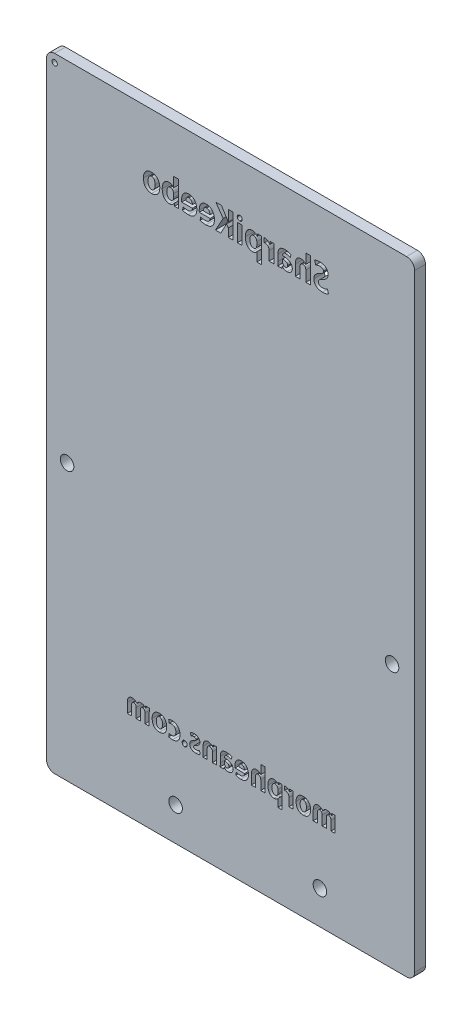
from build123d import *

# Parameters (mm, degrees)
ESQUISSE1_R             = 1.25
BOSS_EXTRU_1_DEPTH      = 2
ESQUISSE2_R             = 0.5
ENL_V_MAT_EXTRU_1_DEPTH = 2
ESQUISSE3_W             = 0.861991937
ESQUISSE3_H             = 3.266441429
ENL_V_MAT_EXTRU_2_DEPTH = 2
ENL_V_MAT_EXTRU_3_DEPTH = 2


with BuildPart() as part:
    # Esquisse1 → Boss.-Extru.1 (new body)
    with BuildSketch(Plane.XY):
        with BuildLine():
            Line((149.09264334, -163.674733602), (214.126931092, -163.674733602))
            ThreePointArc((214.126931092, -163.674733602), (215.187591264, -163.235393774), (215.626931092, -162.174733602))
            Line((215.626931092, -162.174733602), (215.626931092, -49.858733602))
            ThreePointArc((215.626931092, -49.858733602), (215.187591264, -48.79807343), (214.126931092, -48.358733602))
            Line((214.126931092, -48.358733602), (149.09264334, -48.358733602))
            ThreePointArc((149.09264334, -48.358733602), (148.031983168, -48.79807343), (147.59264334, -49.858733602))
            Line((147.59264334, -49.858733602), (147.59264334, -162.174733602))
            ThreePointArc((147.59264334, -162.174733602), (148.031983168, -163.235393774), (149.09264334, -163.674733602))
        make_face()
        with Locations((171.45, -157.48)):
            Circle(ESQUISSE1_R, mode=Mode.SUBTRACT)
        with Locations((151.384, -112.776)):
            Circle(ESQUISSE1_R, mode=Mode.SUBTRACT)
        with Locations((198.12, -157.48)):
            Circle(ESQUISSE1_R, mode=Mode.SUBTRACT)
        with Locations((211.455, -114.935)):
            Circle(ESQUISSE1_R, mode=Mode.SUBTRACT)
    extrude(amount=BOSS_EXTRU_1_DEPTH)

    # Esquisse2 → Enlèv. mat.-Extru.1 (cut)
    with BuildSketch(Plane.XY.offset(2)):
        with Locations((149.09264334, -49.858733602)):
            Circle(ESQUISSE2_R)
    extrude(amount=-ENL_V_MAT_EXTRU_1_DEPTH, mode=Mode.SUBTRACT)

    # Esquisse3 → Enlèv. mat.-Extru.2 (cut)
    # profile 1 of 12: a face of its own
    with BuildSketch(Plane(origin=(0, 0, 0), x_dir=(-1, 0, 0), z_dir=(0, 0, -1))):
        with BuildLine():
            add(Edge.make_bspline(
                [(-199.696856549, -61.593651952), (-199.667160267, -61.610083675), (-199.603791238, -61.645147405), (-199.495699742, -61.686673869), (-199.372587662, -61.728044006), (-199.234007482, -61.763102136), (-199.085310079, -61.794629226), (-198.92917788, -61.817325513), (-198.768012157, -61.832067405), (-198.658605984, -61.834738619), (-198.603144184, -61.836092751)],
                knots=[0, 0, 0, 0, 0.719594672, 1.535546325, 2.452393094, 3.475924305, 4.567249392, 5.677640584, 6.822715122, 8, 8, 8, 8], degree=3))
            add(Edge.make_bspline(
                [(-198.603144184, -61.836092751), (-198.540017231, -61.834505978), (-198.417136534, -61.831417222), (-198.238956878, -61.811024298), (-198.071597509, -61.782398937), (-197.916059626, -61.740232862), (-197.770902265, -61.689341758), (-197.637760938, -61.62511846), (-197.515656748, -61.550270788), (-197.405071856, -61.464759306), (-197.307813575, -61.368977246), (-197.220778336, -61.267612997), (-197.149823753, -61.15665657), (-197.089245203, -61.040130659), (-197.044023626, -60.914948208), (-197.009282573, -60.783097882), (-196.990317487, -60.643194078), (-196.98693729, -60.547681812), (-196.985214022, -60.498988432)],
                knots=[0, 0, 0, 0, 1.280827998, 2.493214574, 3.635842522, 4.723067123, 5.759595453, 6.75296466, 7.716578851, 8.661346905, 9.582605015, 10.482742654, 11.366187061, 12.249109382, 13.142470757, 14.061151216, 15.011549973, 16, 16, 16, 16], degree=3))
            add(Edge.make_bspline(
                [(-196.985214022, -60.498988432), (-196.985819918, -60.462484828), (-196.987015806, -60.390435823), (-196.997869643, -60.28420369), (-197.018089596, -60.182067891), (-197.043525407, -60.082785196), (-197.079942127, -59.988213962), (-197.122136738, -59.896404288), (-197.173583526, -59.809042951), (-197.232187282, -59.724475852), (-197.299884011, -59.643694273), (-197.37570636, -59.565268706), (-197.460548241, -59.489880547), (-197.554713469, -59.417949035), (-197.656335346, -59.347059434), (-197.767705578, -59.280418962), (-197.887801454, -59.216786788), (-197.971479898, -59.177115006), (-198.01434317, -59.156793615)],
                knots=[0, 0, 0, 0, 0.971604692, 1.917705205, 2.837533086, 3.741450306, 4.641944002, 5.53106885, 6.428441787, 7.336893241, 8.26704506, 9.230684205, 10.238479509, 11.285007773, 12.38342881, 13.535071349, 14.737370079, 16, 16, 16, 16], degree=3))
            add(Edge.make_bspline(
                [(-198.01434317, -59.156793615), (-198.046926495, -59.141935498), (-198.110122315, -59.11311797), (-198.200752877, -59.069200861), (-198.284161178, -59.025811532), (-198.360543498, -58.983378926), (-198.4305503, -58.942109557), (-198.492871187, -58.900299371), (-198.549227432, -58.860918546), (-198.598354889, -58.821350009), (-198.641565535, -58.781398), (-198.678333504, -58.738742702), (-198.70923017, -58.693132773), (-198.734567851, -58.645440072), (-198.753607025, -58.594889078), (-198.766863051, -58.542234284), (-198.7761301, -58.486868679), (-198.776190452, -58.448970535), (-198.776221139, -58.429700721)],
                knots=[0, 0, 0, 0, 1.534293153, 2.975783242, 4.314400128, 5.561899513, 6.719353789, 7.794748337, 8.776507069, 9.664015056, 10.495494951, 11.294559956, 12.0708857, 12.851360931, 13.602992373, 14.37884518, 15.175702311, 16, 16, 16, 16], degree=3))
            add(Edge.make_bspline(
                [(-198.776221139, -58.429700721), (-198.774542144, -58.397520046), (-198.771216908, -58.333786465), (-198.740748355, -58.241505442), (-198.690319533, -58.156090911), (-198.632456461, -58.092515793), (-198.576971734, -58.046405299), (-198.528222388, -58.016211232), (-198.4744921, -57.989333622), (-198.414574352, -57.968956635), (-198.349932051, -57.9505194), (-198.279426656, -57.938178034), (-198.20339553, -57.930850982), (-198.150953292, -57.928602743), (-198.123788892, -57.927438185)],
                knots=[0, 0, 0, 0, 1.252807395, 2.481175558, 3.747276352, 5.098962457, 5.812468956, 6.556386487, 7.331171674, 8.151379655, 9.021437812, 9.952148669, 10.939239512, 12, 12, 12, 12], degree=3))
            add(Edge.make_bspline(
                [(-198.123788892, -57.927438185), (-198.079642345, -57.92889958), (-197.99428464, -57.931725199), (-197.870911613, -57.944257697), (-197.756913423, -57.96447637), (-197.652474419, -57.991669564), (-197.558268061, -58.023655875), (-197.473276045, -58.054367084), (-197.398674405, -58.08656582), (-197.353576021, -58.110425185), (-197.332216348, -58.121725551)],
                knots=[0, 0, 0, 0, 1.287765497, 2.48990501, 3.61253477, 4.660633034, 5.633348447, 6.512647364, 7.29555421, 8, 8, 8, 8], degree=3))
            Line((-197.332216348, -58.121725551), (-197.152125872, -57.426423418))
            add(Edge.make_bspline(
                [(-197.152125872, -57.426423418), (-197.180097027, -57.413624659), (-197.238439386, -57.386928952), (-197.332224287, -57.349530914), (-197.43755015, -57.318977547), (-197.551885691, -57.287277668), (-197.676910014, -57.262409691), (-197.811590235, -57.242352442), (-197.956220119, -57.232174957), (-198.055621201, -57.229645766), (-198.106820563, -57.228343034)],
                knots=[0, 0, 0, 0, 0.751083297, 1.566612858, 2.462144976, 3.426904781, 4.462872615, 5.572206229, 6.749495582, 8, 8, 8, 8], degree=3))
            add(Edge.make_bspline(
                [(-198.106820563, -57.228343034), (-198.16569182, -57.230404253), (-198.28032188, -57.234417718), (-198.446833176, -57.253005155), (-198.603205391, -57.282545956), (-198.749325291, -57.323282842), (-198.88594803, -57.373920467), (-199.012234977, -57.436073547), (-199.128459503, -57.509239201), (-199.233440368, -57.593511265), (-199.327842656, -57.685650716), (-199.409491709, -57.785617034), (-199.479923647, -57.891227001), (-199.537100156, -58.004015751), (-199.5811123, -58.123463651), (-199.613336925, -58.2490907), (-199.634399607, -58.381212862), (-199.637486402, -58.471758072), (-199.639060664, -58.517936031)],
                knots=[0, 0, 0, 0, 1.256955866, 2.447457956, 3.572082846, 4.649959342, 5.681406033, 6.67750641, 7.648772353, 8.6065338, 9.545567091, 10.459092244, 11.356420819, 12.24994494, 13.151405518, 14.067877277, 15.01461949, 16, 16, 16, 16], degree=3))
            add(Edge.make_bspline(
                [(-199.639060664, -58.517936031), (-199.637710035, -58.55418473), (-199.635040716, -58.625824946), (-199.620126379, -58.7313826), (-199.597641138, -58.833484887), (-199.565158121, -58.931823096), (-199.523003563, -59.025905), (-199.474159256, -59.117372763), (-199.414926336, -59.204337489), (-199.346769606, -59.287233362), (-199.271391945, -59.366646863), (-199.189120446, -59.442763363), (-199.100180985, -59.515620587), (-199.003764259, -59.58498349), (-198.901371401, -59.652661917), (-198.79056032, -59.714440358), (-198.674287078, -59.775694609), (-198.592901845, -59.811946011), (-198.55139078, -59.830436273)],
                knots=[0, 0, 0, 0, 0.960729928, 1.898741275, 2.820565259, 3.728266954, 4.637606962, 5.549753057, 6.472673147, 7.420779733, 8.390934511, 9.372027768, 10.389211705, 11.435574366, 12.518575566, 13.639649148, 14.796087777, 16, 16, 16, 16], degree=3))
            add(Edge.make_bspline(
                [(-198.55139078, -59.830436273), (-198.493852051, -59.856468875), (-198.385540063, -59.905473136), (-198.238525694, -59.987330601), (-198.115192201, -60.069403387), (-198.016127947, -60.155415489), (-197.937786386, -60.245806386), (-197.884897147, -60.346289816), (-197.851298788, -60.454991807), (-197.848590268, -60.530693275), (-197.84720513, -60.569406997)],
                knots=[0, 0, 0, 0, 1.393665495, 2.6234622, 3.710952145, 4.657720235, 5.513058752, 6.334242817, 7.148131986, 8, 8, 8, 8], degree=3))
            add(Edge.make_bspline(
                [(-197.84720513, -60.569406997), (-197.84760402, -60.590365765), (-197.848383757, -60.63133524), (-197.857109553, -60.691066571), (-197.871343294, -60.747504406), (-197.892240099, -60.800433663), (-197.917415282, -60.850871025), (-197.949162255, -60.897823938), (-197.986791386, -60.941341871), (-198.030088618, -60.981145586), (-198.07878009, -61.016904092), (-198.132750438, -61.048545101), (-198.19213744, -61.07559405), (-198.256952505, -61.097653059), (-198.327175397, -61.114368343), (-198.402537782, -61.127154876), (-198.483657994, -61.13459993), (-198.539498398, -61.136180627), (-198.568359109, -61.136997599)],
                knots=[0, 0, 0, 0, 0.969766496, 1.895666023, 2.788091005, 3.658633537, 4.525326931, 5.393305268, 6.275294433, 7.18343149, 8.110533905, 9.067217099, 10.075045017, 11.126827756, 12.232027601, 13.413846859, 14.663365337, 16, 16, 16, 16], degree=3))
            add(Edge.make_bspline(
                [(-198.568359109, -61.136997599), (-198.613635779, -61.13553428), (-198.703527617, -61.132629022), (-198.837130413, -61.119187321), (-198.968016832, -61.096033715), (-199.095200611, -61.06488045), (-199.216243177, -61.026813722), (-199.32953811, -60.984710892), (-199.433465058, -60.937539931), (-199.497620822, -60.901040476), (-199.528766526, -60.883321082)],
                knots=[0, 0, 0, 0, 1.082450425, 2.149086012, 3.20582521, 4.256603573, 5.276294291, 6.236645749, 7.143944243, 8, 8, 8, 8], degree=3))
            Line((-199.528766526, -60.883321082), (-199.696856549, -61.593651952))
        make_face()
    # profile 2 of 12: a face of its own
    with BuildSketch(Plane(origin=(0, 0, 0), x_dir=(-1, 0, 0), z_dir=(0, 0, -1))):
        with BuildLine():
            Line((-195.518301987, -58.929065053), (-195.518301987, -57.098242846))
            Line((-195.518301987, -57.098242846), (-196.380293924, -57.098242846))
            Line((-196.380293924, -57.098242846), (-196.380293924, -61.796823663))
            Line((-196.380293924, -61.796823663), (-195.518301987, -61.796823663))
            Line((-195.518301987, -61.796823663), (-195.518301987, -59.814674286))
            add(Edge.make_bspline(
                [(-195.518301987, -59.814674286), (-195.516820705, -59.785944056), (-195.51395469, -59.730356207), (-195.501693014, -59.650590029), (-195.485301463, -59.577104585), (-195.462220676, -59.510657186), (-195.434343433, -59.45073902), (-195.401061027, -59.397697784), (-195.362754239, -59.350871686), (-195.304422855, -59.300867032), (-195.228717425, -59.250109575), (-195.135212173, -59.206165272), (-195.041702024, -59.178266852), (-194.978888073, -59.176950845), (-194.948166135, -59.176307193)],
                knots=[0, 0, 0, 0, 1.078943319, 2.087562026, 3.024629729, 3.900630017, 4.721949662, 5.499305595, 6.245311871, 6.982127066, 8.374403556, 9.651575371, 10.851399169, 12, 12, 12, 12], degree=3))
            add(Edge.make_bspline(
                [(-194.948166135, -59.176307193), (-194.924928216, -59.17751826), (-194.880176694, -59.17985053), (-194.815894996, -59.191097836), (-194.756537118, -59.207972013), (-194.702363535, -59.231307427), (-194.653957092, -59.261950662), (-194.610095025, -59.297634299), (-194.571768058, -59.340292842), (-194.528468307, -59.406619123), (-194.48549193, -59.500829252), (-194.448776199, -59.626197765), (-194.428965471, -59.765885124), (-194.42727365, -59.863464369), (-194.426390021, -59.914429501)],
                knots=[0, 0, 0, 0, 0.816336085, 1.572097807, 2.28538196, 2.978976327, 3.634651425, 4.290627153, 4.958517148, 5.638692553, 7.064465951, 8.575630645, 10.211469688, 12, 12, 12, 12], degree=3))
            Line((-194.426390021, -59.914429501), (-194.425542433, -61.796823663))
            Line((-194.425542433, -61.796823663), (-193.563551324, -61.796823663))
            Line((-193.563551324, -61.796823663), (-193.563551324, -59.843996022))
            add(Edge.make_bspline(
                [(-193.563551324, -59.843996022), (-193.565516046, -59.786561289), (-193.569306997, -59.675740334), (-193.584226475, -59.515266149), (-193.608707402, -59.366717837), (-193.641416605, -59.229884187), (-193.682638673, -59.104868429), (-193.734001757, -58.99222614), (-193.792785404, -58.890553929), (-193.86158977, -58.801891265), (-193.936297587, -58.724025901), (-194.01770451, -58.658021406), (-194.102384758, -58.600557305), (-194.19249937, -58.553901464), (-194.288327548, -58.519641991), (-194.388467081, -58.493776627), (-194.493830792, -58.47921937), (-194.565487026, -58.477889774), (-194.602012225, -58.477212042)],
                knots=[0, 0, 0, 0, 1.422346914, 2.74443411, 3.986205041, 5.145859495, 6.22393852, 7.238967389, 8.205448923, 9.123965179, 10.01014068, 10.870616321, 11.71325216, 12.539799407, 13.374723238, 14.227044698, 15.096274766, 16, 16, 16, 16], degree=3))
            add(Edge.make_bspline(
                [(-194.602012225, -58.477212042), (-194.639988047, -58.477967019), (-194.717247955, -58.479502983), (-194.834257208, -58.499801719), (-194.954155486, -58.530744556), (-195.07497977, -58.576567522), (-195.194419444, -58.636908323), (-195.306928514, -58.717228413), (-195.413334308, -58.81419611), (-195.474866194, -58.890357161), (-195.506424156, -58.929418007)],
                knots=[0, 0, 0, 0, 0.868041429, 1.765986845, 2.7093528, 3.6985517, 4.717345826, 5.762297569, 6.852345783, 8, 8, 8, 8], degree=3))
            Line((-195.506424156, -58.929418007), (-195.518301987, -58.929065053))
        make_face()
    # profile 3 of 12: a face of its own
    with BuildSketch(Plane(origin=(0, 0, 0), x_dir=(-1, 0, 0), z_dir=(0, 0, -1))):
        with BuildLine():
            add(Edge.make_bspline(
                [(-192.615473287, -59.303526576), (-192.587884268, -59.286361478), (-192.531604279, -59.251345681), (-192.440893686, -59.207535935), (-192.345123676, -59.166957423), (-192.244219063, -59.132517029), (-192.139253021, -59.104932556), (-192.032632793, -59.082952202), (-191.923806274, -59.071458311), (-191.850902505, -59.06896699), (-191.814115784, -59.067709888)],
                knots=[0, 0, 0, 0, 0.92116327, 1.879119297, 2.853562296, 3.87091793, 4.900348678, 5.930904215, 6.955949054, 8, 8, 8, 8], degree=3))
            add(Edge.make_bspline(
                [(-191.814115784, -59.067709888), (-191.786928347, -59.068333087), (-191.734366121, -59.069537934), (-191.659334091, -59.079470435), (-191.590559711, -59.092137283), (-191.529437698, -59.112180057), (-191.474136463, -59.135365643), (-191.426660345, -59.165261565), (-191.385398143, -59.199806161), (-191.340677566, -59.253517947), (-191.2962413, -59.330455789), (-191.261221263, -59.434034886), (-191.239832864, -59.548725622), (-191.240327617, -59.628978773), (-191.240586267, -59.670933981)],
                knots=[0, 0, 0, 0, 1.015501891, 1.963297894, 2.825560386, 3.624409854, 4.362726652, 5.060679176, 5.712965577, 6.365251979, 7.663128898, 9.006844189, 10.435220624, 12, 12, 12, 12], degree=3))
            add(Edge.make_bspline(
                [(-191.240586267, -59.670933981), (-191.303959496, -59.67165241), (-191.428030658, -59.67305894), (-191.609606826, -59.686854796), (-191.782166324, -59.709485387), (-191.945512673, -59.741447637), (-192.099535631, -59.783420735), (-192.245274359, -59.832719057), (-192.381513082, -59.893566928), (-192.508587192, -59.962497036), (-192.624992337, -60.040576796), (-192.725534091, -60.131265341), (-192.811921765, -60.231607325), (-192.882359634, -60.342760808), (-192.939141435, -60.46382919), (-192.980465923, -60.595318787), (-193.007280371, -60.737200523), (-193.012132109, -60.835405911), (-193.014625055, -60.885866331)],
                knots=[0, 0, 0, 0, 1.257977162, 2.462848908, 3.612643946, 4.711551888, 5.764370023, 6.780002296, 7.762808841, 8.722621342, 9.647663435, 10.538241288, 11.402392885, 12.268366511, 13.142456214, 14.049813262, 14.997944576, 16, 16, 16, 16], degree=3))
            add(Edge.make_bspline(
                [(-193.014625055, -60.885866331), (-193.013582823, -60.91872521), (-193.011534321, -60.983309197), (-192.997303065, -61.077787171), (-192.976448565, -61.168560246), (-192.946438747, -61.25466789), (-192.909977704, -61.33755189), (-192.864057202, -61.415293362), (-192.809783396, -61.488673021), (-192.74944586, -61.558378905), (-192.680549883, -61.620908793), (-192.605510569, -61.676334955), (-192.524459201, -61.7243832), (-192.436671862, -61.763322622), (-192.342719958, -61.793663522), (-192.242875857, -61.81681083), (-192.136613191, -61.8310601), (-192.063591479, -61.834389041), (-192.026219896, -61.836092751)],
                knots=[0, 0, 0, 0, 1.027322353, 2.019197713, 2.982425992, 3.936187424, 4.866532966, 5.810028182, 6.752901381, 7.718036202, 8.688384618, 9.655988284, 10.631321951, 11.629016196, 12.652677156, 13.714668757, 14.830396542, 16, 16, 16, 16], degree=3))
            add(Edge.make_bspline(
                [(-192.026219896, -61.836092751), (-191.982320859, -61.834698188), (-191.896101081, -61.831959203), (-191.769748211, -61.813063995), (-191.649757349, -61.781634952), (-191.536344059, -61.738426765), (-191.431281779, -61.683395034), (-191.335282072, -61.61770468), (-191.249105213, -61.540852356), (-191.200534514, -61.481573502), (-191.176106617, -61.451760101)],
                knots=[0, 0, 0, 0, 1.089521257, 2.139871092, 3.163177725, 4.163102539, 5.145903192, 6.1000057, 7.044426644, 8, 8, 8, 8], degree=3))
            Line((-191.176106617, -61.451760101), (-191.157727299, -61.451690504))
            Line((-191.157727299, -61.451690504), (-191.104485853, -61.774811233))
            Line((-191.104485853, -61.774811233), (-190.318106545, -61.774811233))
            add(Edge.make_bspline(
                [(-190.318106545, -61.774811233), (-190.322345726, -61.749735449), (-190.331146284, -61.697678016), (-190.340882293, -61.61618269), (-190.349707184, -61.528814927), (-190.356957993, -61.402047034), (-190.364861071, -61.23437565), (-190.365527082, -61.09770042), (-190.365868911, -61.027551878)],
                knots=[0, 0, 0, 0, 0.610548939, 1.267502157, 1.970203817, 2.718660699, 4.315853085, 6, 6, 6, 6], degree=3))
            Line((-190.365868911, -61.027551878), (-190.365021323, -59.840276744))
            add(Edge.make_bspline(
                [(-190.365021323, -59.840276744), (-190.36499419, -59.793713381), (-190.364940775, -59.702045861), (-190.375018398, -59.56713217), (-190.39476982, -59.437925725), (-190.422085249, -59.314153252), (-190.460897337, -59.196967574), (-190.507240248, -59.085074777), (-190.564010287, -58.979463851), (-190.628348496, -58.878778224), (-190.706093921, -58.786687937), (-190.798779202, -58.706338761), (-190.906095274, -58.638078145), (-191.027932703, -58.58233282), (-191.163607612, -58.537353142), (-191.314047824, -58.504782256), (-191.478700952, -58.483576997), (-191.593460891, -58.479384253), (-191.65291666, -58.477212042)],
                knots=[0, 0, 0, 0, 1.037939004, 2.043351001, 3.012684027, 3.950348011, 4.865589174, 5.761446226, 6.647171701, 7.535608735, 8.421289321, 9.324087164, 10.259862385, 11.247218489, 12.30401033, 13.440682476, 14.674047819, 16, 16, 16, 16], degree=3))
            add(Edge.make_bspline(
                [(-191.65291666, -58.477212042), (-191.714046827, -58.478674923), (-191.833148091, -58.481525086), (-192.006239753, -58.498973893), (-192.168747063, -58.524674863), (-192.319259078, -58.560512776), (-192.456236275, -58.601998698), (-192.579261289, -58.645176266), (-192.687172936, -58.689894969), (-192.751854414, -58.72474271), (-192.782158949, -58.741069556)],
                knots=[0, 0, 0, 0, 1.252902983, 2.441058744, 3.56267823, 4.62278865, 5.609386748, 6.494886694, 7.294825038, 8, 8, 8, 8], degree=3))
            Line((-192.782158949, -58.741069556), (-192.615473287, -59.303526576))
        make_face()
        with BuildLine():
            add(Edge.make_bspline(
                [(-191.216831435, -60.679197388), (-191.218789928, -60.704278196), (-191.222576354, -60.752767827), (-191.233013875, -60.822719527), (-191.250407505, -60.886405893), (-191.271187082, -60.944712889), (-191.297873375, -60.997040564), (-191.329133765, -61.044070017), (-191.366147038, -61.085338625), (-191.420880418, -61.131498769), (-191.492590465, -61.17723938), (-191.579776743, -61.216984619), (-191.665230169, -61.243244838), (-191.722595941, -61.244826145), (-191.750484551, -61.245594904)],
                knots=[0, 0, 0, 0, 1.043926595, 2.0182609, 2.929185394, 3.779426585, 4.582434006, 5.360352114, 6.116635953, 6.874011636, 8.325857533, 9.628293333, 10.846984866, 12, 12, 12, 12], degree=3))
            add(Edge.make_bspline(
                [(-191.750484551, -61.245594904), (-191.776933091, -61.244712664), (-191.828975593, -61.242976689), (-191.903465041, -61.221541036), (-191.97234893, -61.188003816), (-192.033908531, -61.140116082), (-192.086394866, -61.077281677), (-192.122384227, -60.99692712), (-192.146491019, -60.902504449), (-192.149949404, -60.834000923), (-192.15178553, -60.797631021)],
                knots=[0, 0, 0, 0, 0.932689269, 1.835242495, 2.716319968, 3.628517603, 4.573510817, 5.580053048, 6.715201435, 8, 8, 8, 8], degree=3))
            add(Edge.make_bspline(
                [(-192.15178553, -60.797631021), (-192.150041153, -60.769521205), (-192.146661833, -60.715065039), (-192.128687941, -60.637936664), (-192.105798378, -60.566782759), (-192.071846572, -60.50383321), (-192.03130804, -60.446447731), (-191.980180284, -60.398523012), (-191.922585752, -60.355618261), (-191.833104117, -60.310357719), (-191.710842325, -60.26693705), (-191.5553534, -60.229066977), (-191.389615245, -60.208667277), (-191.275989226, -60.208214134), (-191.217679023, -60.207981591)],
                knots=[0, 0, 0, 0, 0.812232766, 1.573510204, 2.281488938, 2.964950378, 3.63174977, 4.302044204, 4.980259673, 5.700253563, 7.189246091, 8.719149585, 10.31634467, 12, 12, 12, 12], degree=3))
            Line((-191.217679023, -60.207981591), (-191.216831435, -60.679197388))
        make_face(mode=Mode.SUBTRACT)
    # profile 4 of 12: a face of its own
    with BuildSketch(Plane(origin=(0, 0, 0), x_dir=(-1, 0, 0), z_dir=(0, 0, -1))):
        with BuildLine():
            Line((-188.841637398, -59.10074676), (-188.876584864, -58.545085357))
            Line((-188.876584864, -58.545085357), (-189.616419747, -58.545085357))
            add(Edge.make_bspline(
                [(-189.616419747, -58.545085357), (-189.613604853, -58.618894845), (-189.607770652, -58.771873729), (-189.601751988, -58.966737996), (-189.596638016, -59.132167608), (-189.595720183, -59.264828271), (-189.593292588, -59.404524122), (-189.593634454, -59.499835428), (-189.593809946, -59.548762013)],
                knots=[0, 0, 0, 0, 1.324207679, 2.744576904, 3.495229973, 4.291304775, 5.122867722, 6, 6, 6, 6], degree=3))
            Line((-189.593809946, -59.548762013), (-189.592962358, -61.79399837))
            Line((-189.592962358, -61.79399837), (-188.73097042, -61.79399837))
            Line((-188.73097042, -61.79399837), (-188.73097042, -60.105066356))
            add(Edge.make_bspline(
                [(-188.73097042, -60.105066356), (-188.730017564, -60.071471509), (-188.728169243, -60.006305314), (-188.717909158, -59.911958379), (-188.701982909, -59.824277641), (-188.680192968, -59.743211777), (-188.651673262, -59.669105688), (-188.619505398, -59.600505233), (-188.578587968, -59.540112286), (-188.533937487, -59.485263791), (-188.483649415, -59.43825937), (-188.430522417, -59.396603836), (-188.373559395, -59.362250903), (-188.313709348, -59.332622971), (-188.249795902, -59.310684504), (-188.18258848, -59.295830778), (-188.112210913, -59.285807975), (-188.064151653, -59.285210719), (-188.039511017, -59.284904498)],
                knots=[0, 0, 0, 0, 1.328993375, 2.577938255, 3.749595128, 4.851401761, 5.892294362, 6.887899519, 7.84040204, 8.769965346, 9.679936652, 10.557066843, 11.435764995, 12.306307666, 13.19428498, 14.100673707, 15.026189549, 16, 16, 16, 16], degree=3))
            add(Edge.make_bspline(
                [(-188.039511017, -59.284904498), (-187.999277195, -59.285368759), (-187.924518591, -59.286231404), (-187.850541403, -59.296931392), (-187.816377492, -59.301872827)],
                knots=[0, 0, 0, 0, 1.076366321, 2, 2, 2, 2], degree=3))
            Line((-187.816377492, -59.301872827), (-187.816132246, -58.493529145))
            add(Edge.make_bspline(
                [(-187.816132246, -58.493529145), (-187.845557454, -58.488452703), (-187.909620002, -58.477400622), (-187.974653908, -58.477278221), (-188.009816441, -58.477212042)],
                knots=[0, 0, 0, 0, 0.918639949, 2, 2, 2, 2], degree=3))
            add(Edge.make_bspline(
                [(-188.009816441, -58.477212042), (-188.049287261, -58.479334137), (-188.128692567, -58.483603256), (-188.246691013, -58.513627973), (-188.362211578, -58.564246497), (-188.475508547, -58.632372335), (-188.58195021, -58.72030881), (-188.675046153, -58.82964748), (-188.756744872, -58.956660899), (-188.797387226, -59.051740337), (-188.818357314, -59.100798129)],
                knots=[0, 0, 0, 0, 0.873024494, 1.756304479, 2.675727742, 3.655517484, 4.673026258, 5.715548879, 6.821300036, 8, 8, 8, 8], degree=3))
            Line((-188.818357314, -59.100798129), (-188.841637398, -59.10074676))
        make_face()
    # profile 5 of 12: a face of its own
    with BuildSketch(Plane(origin=(0, 0, 0), x_dir=(-1, 0, 0), z_dir=(0, 0, -1))):
        with BuildLine():
            Line((-186.584392302, -58.493056882), (-187.335876341, -58.493056882))
            add(Edge.make_bspline(
                [(-187.335876341, -58.493056882), (-187.332673317, -58.570630498), (-187.325968872, -58.733004631), (-187.319379886, -58.988494429), (-187.315387398, -59.26679411), (-187.313991165, -59.46024273), (-187.313266539, -59.560639843)],
                knots=[0, 0, 0, 0, 0.872434831, 1.826147295, 2.87180102, 4, 4, 4, 4], degree=3))
            Line((-187.313266539, -59.560639843), (-187.312418951, -63.074243873))
            Line((-187.312418951, -63.074243873), (-186.450427014, -63.074243873))
            Line((-186.450427014, -63.074243873), (-186.450427014, -61.444972769))
            Line((-186.450427014, -61.444972769), (-186.438617952, -61.444972769))
            add(Edge.make_bspline(
                [(-186.438617952, -61.444972769), (-186.41987216, -61.472463633), (-186.3819409, -61.528090149), (-186.309437675, -61.60107125), (-186.225162024, -61.665427879), (-186.131503636, -61.72357845), (-186.026814188, -61.770140057), (-185.912777972, -61.80405111), (-185.789733825, -61.825594004), (-185.7044764, -61.82916332), (-185.660551303, -61.831002252)],
                knots=[0, 0, 0, 0, 0.880714621, 1.782086131, 2.711947099, 3.687971414, 4.6982148, 5.73955997, 6.83540878, 8, 8, 8, 8], degree=3))
            add(Edge.make_bspline(
                [(-185.660551303, -61.831002252), (-185.618064097, -61.829927069), (-185.533801284, -61.82779471), (-185.409387906, -61.80871112), (-185.28892734, -61.776494497), (-185.172857807, -61.729916938), (-185.060122218, -61.671085882), (-184.951180344, -61.598610899), (-184.846844405, -61.512220375), (-184.746297752, -61.413720461), (-184.652147279, -61.301519335), (-184.571962236, -61.171734208), (-184.502109006, -61.028188761), (-184.443626111, -60.869982384), (-184.398152037, -60.696565441), (-184.365032718, -60.508670247), (-184.341560485, -60.306090683), (-184.336331218, -60.165910584), (-184.333627982, -60.093445371)],
                knots=[0, 0, 0, 0, 0.833019025, 1.652086204, 2.462180915, 3.273926424, 4.100194538, 4.9525683, 5.835462923, 6.753389615, 7.710846528, 8.700498071, 9.737554625, 10.838085599, 12.00337457, 13.249274384, 14.578029827, 16, 16, 16, 16], degree=3))
            add(Edge.make_bspline(
                [(-184.333627982, -60.093445371), (-184.335386785, -60.031466127), (-184.338815142, -59.910652726), (-184.356973305, -59.734384994), (-184.384563024, -59.567924673), (-184.422564799, -59.411269618), (-184.471074427, -59.264572462), (-184.529421948, -59.127098516), (-184.599253922, -58.999832115), (-184.677861435, -58.882544472), (-184.765046062, -58.777242334), (-184.859550589, -58.685177677), (-184.960242798, -58.606106639), (-185.067790798, -58.54148959), (-185.181437672, -58.48959441), (-185.302333323, -58.453798487), (-185.429073602, -58.428849779), (-185.51619932, -58.424912551), (-185.560438162, -58.422913389)],
                knots=[0, 0, 0, 0, 1.287756241, 2.510166304, 3.677914371, 4.79081245, 5.855392705, 6.884510189, 7.888878388, 8.866584042, 9.813659286, 10.723557861, 11.602642665, 12.467156869, 13.324393567, 14.19046355, 15.081192111, 16, 16, 16, 16], degree=3))
            add(Edge.make_bspline(
                [(-185.560438162, -58.422913389), (-185.612577231, -58.424813513), (-185.714381305, -58.428523598), (-185.862061653, -58.45429113), (-185.999374832, -58.496268637), (-186.127749837, -58.551868066), (-186.244355129, -58.626285089), (-186.352446116, -58.714087575), (-186.450378971, -58.818413863), (-186.504899385, -58.898089045), (-186.532723409, -58.938750588)],
                knots=[0, 0, 0, 0, 1.086953167, 2.122329029, 3.114714223, 4.075679785, 5.029526715, 5.989188732, 6.973799774, 8, 8, 8, 8], degree=3))
            Line((-186.532723409, -58.938750588), (-186.543620258, -58.938747274))
            Line((-186.543620258, -58.938747274), (-186.584392302, -58.493056882))
        make_face()
        with BuildLine():
            add(Edge.make_bspline(
                [(-186.450427014, -59.829587856), (-186.447900659, -59.781273441), (-186.443004606, -59.687640508), (-186.40746377, -59.554212063), (-186.354439882, -59.432666626), (-186.292015341, -59.343660227), (-186.234447129, -59.281099797), (-186.187675019, -59.240246777), (-186.137936641, -59.205525959), (-186.086448116, -59.174779576), (-186.030428694, -59.153489111), (-185.972696788, -59.13612332), (-185.912081415, -59.124914136), (-185.870720124, -59.122423157), (-185.84974817, -59.121160124)],
                knots=[0, 0, 0, 0, 1.686726831, 3.268862506, 4.795218998, 6.300437724, 7.041767852, 7.763265046, 8.465273548, 9.160360029, 9.852277247, 10.552823157, 11.266219121, 12, 12, 12, 12], degree=3))
            add(Edge.make_bspline(
                [(-185.84974817, -59.121160124), (-185.823662441, -59.122502976), (-185.772514598, -59.125135985), (-185.698375496, -59.139822446), (-185.629007796, -59.162704131), (-185.564679538, -59.194316581), (-185.505949711, -59.234720503), (-185.451441257, -59.282624682), (-185.403515948, -59.340287513), (-185.359381102, -59.404709529), (-185.320529997, -59.475815841), (-185.287676526, -59.553083286), (-185.258436329, -59.635042798), (-185.236270438, -59.723001399), (-185.217002043, -59.815428644), (-185.204869566, -59.913320341), (-185.19694628, -60.016389466), (-185.196069342, -60.08692466), (-185.195619091, -60.123139947)],
                knots=[0, 0, 0, 0, 0.935867529, 1.835011164, 2.701048921, 3.549322375, 4.396139147, 5.25111747, 6.143369254, 7.077421111, 8.048836738, 9.043745302, 10.086321518, 11.16636512, 12.294263889, 13.470607517, 14.701319613, 16, 16, 16, 16], degree=3))
            add(Edge.make_bspline(
                [(-185.195619091, -60.123139947), (-185.196112712, -60.15963222), (-185.197078126, -60.231003043), (-185.204451979, -60.335316195), (-185.2183488, -60.434395659), (-185.236575346, -60.528289416), (-185.260703228, -60.617194683), (-185.288884786, -60.701242837), (-185.324162357, -60.779593106), (-185.363678317, -60.852506348), (-185.407991791, -60.918909403), (-185.458891757, -60.976371326), (-185.514132468, -61.026025205), (-185.574690513, -61.067387258), (-185.641116569, -61.098574785), (-185.711787372, -61.122906421), (-185.78814261, -61.137030884), (-185.840645892, -61.14037403), (-185.867564916, -61.142088098)],
                knots=[0, 0, 0, 0, 1.283057567, 2.509377056, 3.673742815, 4.798940461, 5.869887558, 6.910729667, 7.912262172, 8.886775332, 9.82447372, 10.712177734, 11.578403903, 12.43059094, 13.280047066, 14.15105402, 15.052024584, 16, 16, 16, 16], degree=3))
            add(Edge.make_bspline(
                [(-185.867564916, -61.142088098), (-185.904891722, -61.140424326), (-185.978832104, -61.137128573), (-186.084799728, -61.101642794), (-186.184070468, -61.047273909), (-186.257997319, -60.983670707), (-186.311686503, -60.92314007), (-186.346605756, -60.87026319), (-186.377304087, -60.812434418), (-186.402795117, -60.748762092), (-186.421813167, -60.679173197), (-186.437563365, -60.604477568), (-186.446267261, -60.523769901), (-186.449014636, -60.468178079), (-186.450427014, -60.439599281)],
                knots=[0, 0, 0, 0, 1.310090046, 2.595147259, 3.892303463, 5.277140479, 6.004146831, 6.736115741, 7.502375817, 8.306837944, 9.145406286, 10.039943247, 10.992368591, 12, 12, 12, 12], degree=3))
            Line((-186.450427014, -60.439599281), (-186.450427014, -59.829587856))
        make_face(mode=Mode.SUBTRACT)
    # profile 6 of 12: a face of its own
    with BuildSketch(Plane(origin=(0, 0, 0), x_dir=(-1, 0, 0), z_dir=(0, 0, -1))):
        with BuildLine():
            add(Edge.make_bspline(
                [(-182.837394211, -57.631374815), (-182.839599179, -57.598984279), (-182.843857408, -57.536431771), (-182.867505388, -57.447218406), (-182.908192643, -57.368293703), (-182.964174243, -57.300896563), (-183.032309476, -57.244880663), (-183.113203297, -57.204646688), (-183.204902001, -57.179510951), (-183.269827491, -57.17591677), (-183.303650417, -57.174044381)],
                knots=[0, 0, 0, 0, 1.0628526, 2.052577784, 3.002270958, 3.950877112, 4.906661741, 5.872869434, 6.891871596, 8, 8, 8, 8], degree=3))
            add(Edge.make_bspline(
                [(-183.303650417, -57.174044381), (-183.336350264, -57.175918778), (-183.399338273, -57.179529331), (-183.488680241, -57.20496926), (-183.568346173, -57.245114049), (-183.636395988, -57.300849918), (-183.692232691, -57.368509545), (-183.733799189, -57.447107521), (-183.75875832, -57.536548331), (-183.762432907, -57.59950545), (-183.764340547, -57.632189262)],
                knots=[0, 0, 0, 0, 1.078872945, 2.078176622, 3.042978182, 4.005607781, 4.961007496, 5.921823378, 6.921127055, 8, 8, 8, 8], degree=3))
            add(Edge.make_bspline(
                [(-183.764340547, -57.632189262), (-183.762436771, -57.664042624), (-183.758739119, -57.725910577), (-183.733282964, -57.81366595), (-183.693953317, -57.892734723), (-183.638938144, -57.961183009), (-183.570906878, -58.017410691), (-183.491230035, -58.058970049), (-183.400658227, -58.083788488), (-183.33689522, -58.088090931), (-183.303650417, -58.090334142)],
                knots=[0, 0, 0, 0, 1.051693418, 2.042676611, 2.99556181, 3.952972936, 4.922169701, 5.89190696, 6.900880919, 8, 8, 8, 8], degree=3))
            add(Edge.make_bspline(
                [(-183.303650417, -58.090334142), (-183.270981035, -58.088693607), (-183.207830157, -58.085522403), (-183.117972111, -58.061441169), (-183.038327209, -58.021213521), (-182.96788802, -57.968233982), (-182.911923085, -57.900005259), (-182.868642896, -57.82133001), (-182.844558307, -57.729959782), (-182.840161625, -57.665690574), (-182.837394211, -57.631374815)],
                knots=[0, 0, 0, 0, 1.069775721, 2.067908052, 3.021147403, 3.979463785, 4.933468663, 5.891292003, 6.900803572, 8, 8, 8, 8], degree=3))
        make_face()
    # profile 7 of 12: a face of its own
    with BuildSketch(Plane(origin=(0, 0, 0), x_dir=(-1, 0, 0), z_dir=(0, 0, -1))):
        with Locations((-183.297711916, -60.150805449)):
            Rectangle(ESQUISSE3_W, ESQUISSE3_H)
    # profile 8 of 12: a face of its own
    with BuildSketch(Plane(origin=(0, 0, 0), x_dir=(-1, 0, 0), z_dir=(0, 0, -1))):
        with BuildLine():
            Line((-178.878769242, -57.281794098), (-179.910894361, -57.281794098))
            Line((-179.910894361, -57.281794098), (-180.87851166, -58.803167178))
            add(Edge.make_bspline(
                [(-180.87851166, -58.803167178), (-180.926521672, -58.888467326), (-181.023087992, -59.060038236), (-181.118508985, -59.232248772), (-181.16648939, -59.318841156)],
                knots=[0, 0, 0, 0, 0.99434278, 2, 2, 2, 2], degree=3))
            Line((-181.16648939, -59.318841156), (-181.183457718, -59.318136076))
            Line((-181.183457718, -59.318136076), (-181.183457718, -57.281794098))
            Line((-181.183457718, -57.281794098), (-182.045449656, -57.281794098))
            Line((-182.045449656, -57.281794098), (-182.045449656, -61.781794098))
            Line((-182.045449656, -61.781794098), (-181.183457718, -61.781794098))
            Line((-181.183457718, -61.781794098), (-181.183457718, -60.242739324))
            Line((-181.183457718, -60.242739324), (-180.849189924, -59.792141538))
            Line((-180.849189924, -59.792141538), (-179.80533611, -61.781794098))
            Line((-179.80533611, -61.781794098), (-178.814261422, -61.781794098))
            Line((-178.814261422, -61.781794098), (-180.239297808, -59.206949609))
            Line((-180.239297808, -59.206949609), (-178.878769242, -57.281794098))
        make_face()
    # profile 9 of 12: a face of its own
    with BuildSketch(Plane(origin=(0, 0, 0), x_dir=(-1, 0, 0), z_dir=(0, 0, -1))):
        with BuildLine():
            add(Edge.make_bspline(
                [(-175.833487776, -60.424328613), (-175.82981759, -60.399752964), (-175.822119054, -60.348203376), (-175.814790127, -60.266933028), (-175.810508866, -60.178900853), (-175.810461044, -60.118054706), (-175.810436367, -60.086658039)],
                knots=[0, 0, 0, 0, 0.879814102, 1.845487553, 2.888269607, 4, 4, 4, 4], degree=3))
            add(Edge.make_bspline(
                [(-175.810436367, -60.086658039), (-175.811843797, -60.022416528), (-175.814577434, -59.897640859), (-175.832666671, -59.716503959), (-175.860885407, -59.547356536), (-175.900945384, -59.390512637), (-175.950668719, -59.245423742), (-176.011555015, -59.112350224), (-176.084228076, -58.991968288), (-176.166501184, -58.883594266), (-176.258961154, -58.788237449), (-176.359005632, -58.704112476), (-176.468700986, -58.635020269), (-176.584842357, -58.575762488), (-176.710483567, -58.532632859), (-176.84351215, -58.499707285), (-176.984987793, -58.481403893), (-177.081881006, -58.478630188), (-177.131420773, -58.477212042)],
                knots=[0, 0, 0, 0, 1.306657607, 2.537908493, 3.699270234, 4.791739878, 5.826909547, 6.815290999, 7.762398175, 8.68170366, 9.57675071, 10.459137333, 11.333612719, 12.208315133, 13.105301175, 14.028952094, 14.992238463, 16, 16, 16, 16], degree=3))
            add(Edge.make_bspline(
                [(-177.131420773, -58.477212042), (-177.190347056, -58.480348864), (-177.305110624, -58.486458073), (-177.471763843, -58.51387235), (-177.627573529, -58.556223178), (-177.773101328, -58.612931213), (-177.9070711, -58.685669253), (-178.030515147, -58.772663764), (-178.142197935, -58.875586896), (-178.242639102, -58.992012167), (-178.332374225, -59.118811197), (-178.409277297, -59.254606413), (-178.476422326, -59.396542309), (-178.529184106, -59.546675573), (-178.572038848, -59.703095729), (-178.602227456, -59.866563723), (-178.621428625, -60.036995538), (-178.624113633, -60.153065058), (-178.625482134, -60.212223673)],
                knots=[0, 0, 0, 0, 1.102218766, 2.14665769, 3.149339139, 4.115122672, 5.058741015, 5.991431174, 6.93040496, 7.889527187, 8.860316271, 9.828598601, 10.80279168, 11.790822775, 12.798603709, 13.831085196, 14.894541863, 16, 16, 16, 16], degree=3))
            add(Edge.make_bspline(
                [(-178.625482134, -60.212223673), (-178.624307494, -60.273661497), (-178.622021722, -60.393215388), (-178.600561921, -60.567274108), (-178.569239558, -60.731547296), (-178.523826808, -60.885584244), (-178.467737923, -61.030101418), (-178.396143184, -61.16308314), (-178.313944057, -61.287032076), (-178.218629948, -61.400043036), (-178.11157927, -61.501812751), (-177.991667992, -61.589303048), (-177.861270913, -61.664549196), (-177.719032538, -61.725615807), (-177.565873478, -61.774078028), (-177.400974153, -61.808240733), (-177.225077467, -61.830883677), (-177.103778639, -61.83432536), (-177.04148863, -61.836092751)],
                knots=[0, 0, 0, 0, 1.145056205, 2.228202694, 3.265464393, 4.259985655, 5.218630789, 6.1504322, 7.070355583, 7.987236137, 8.901139799, 9.817656355, 10.748382851, 11.702521477, 12.69814653, 13.738580065, 14.838703788, 16, 16, 16, 16], degree=3))
            add(Edge.make_bspline(
                [(-177.04148863, -61.836092751), (-176.990002904, -61.835405441), (-176.88864368, -61.834052345), (-176.738915273, -61.824412295), (-176.594219353, -61.809503674), (-176.455295881, -61.78809417), (-176.32286089, -61.762402203), (-176.198970904, -61.730064174), (-176.083104067, -61.693999348), (-176.010486715, -61.664629998), (-175.975029158, -61.650289549)],
                knots=[0, 0, 0, 0, 1.134244074, 2.232970358, 3.304290349, 4.337913843, 5.328893587, 6.274899807, 7.157669119, 8, 8, 8, 8], degree=3))
            Line((-175.975029158, -61.650289549), (-176.097383403, -61.0586649))
            add(Edge.make_bspline(
                [(-176.097383403, -61.0586649), (-176.154094512, -61.07813452), (-176.272354157, -61.11873451), (-176.465062135, -61.156271977), (-176.676784447, -61.183334346), (-176.825045444, -61.188567631), (-176.902348333, -61.191296252)],
                knots=[0, 0, 0, 0, 0.87704573, 1.828902987, 2.867995791, 4, 4, 4, 4], degree=3))
            add(Edge.make_bspline(
                [(-176.902348333, -61.191296252), (-176.932625041, -61.191160869), (-176.992434404, -61.19089343), (-177.080330165, -61.183073273), (-177.164638548, -61.169810698), (-177.244954359, -61.14967454), (-177.32255853, -61.12573992), (-177.3960514, -61.093982238), (-177.466271043, -61.057372711), (-177.532611361, -61.015141138), (-177.593954532, -60.966355002), (-177.647699649, -60.909515672), (-177.695153839, -60.846410124), (-177.733540968, -60.775385185), (-177.76678227, -60.698145161), (-177.79028402, -60.613255695), (-177.80893692, -60.521729149), (-177.814214078, -60.458073049), (-177.816941262, -60.425176201)],
                knots=[0, 0, 0, 0, 1.08234867, 2.138098532, 3.15234098, 4.131067708, 5.097013137, 6.053166887, 6.989593978, 7.926621641, 8.861682363, 9.784465562, 10.716952089, 11.676682853, 12.664718862, 13.717752465, 14.820556852, 16, 16, 16, 16], degree=3))
            Line((-177.816941262, -60.425176201), (-175.833487776, -60.424328613))
        make_face()
        with BuildLine():
            add(Edge.make_bspline(
                [(-177.816941262, -59.833829939), (-177.812638195, -59.790399548), (-177.80398928, -59.703106976), (-177.771318471, -59.574145837), (-177.719776938, -59.448655939), (-177.666044634, -59.347013927), (-177.61433097, -59.270250808), (-177.568644588, -59.219488237), (-177.517678428, -59.175926296), (-177.461079677, -59.140375326), (-177.400021179, -59.110880737), (-177.333242588, -59.089096698), (-177.261307199, -59.073490821), (-177.211250681, -59.069662512), (-177.185719426, -59.067709888)],
                knots=[0, 0, 0, 0, 1.434019087, 2.882295425, 4.35559367, 5.887023456, 6.655881304, 7.39355732, 8.125995891, 8.853635031, 9.585837332, 10.350577125, 11.158714241, 12, 12, 12, 12], degree=3))
            add(Edge.make_bspline(
                [(-177.185719426, -59.067709888), (-177.159648868, -59.069800796), (-177.109184811, -59.073848107), (-177.036479656, -59.087192959), (-176.969777306, -59.108063874), (-176.910077166, -59.13759537), (-176.855463838, -59.172304498), (-176.807873023, -59.215405417), (-176.765691407, -59.264749449), (-176.720242159, -59.340261229), (-176.675523959, -59.441315074), (-176.635061824, -59.567673068), (-176.614819265, -59.699671946), (-176.614199694, -59.788806858), (-176.613886741, -59.833829939)],
                knots=[0, 0, 0, 0, 0.873766243, 1.691325154, 2.465551819, 3.201135629, 3.9116346, 4.62125276, 5.338946048, 6.073375047, 7.558144449, 9.023104326, 10.496335382, 12, 12, 12, 12], degree=3))
            Line((-176.613886741, -59.833829939), (-177.816941262, -59.833829939))
        make_face(mode=Mode.SUBTRACT)
    # profile 10 of 12: a face of its own
    with BuildSketch(Plane(origin=(0, 0, 0), x_dir=(-1, 0, 0), z_dir=(0, 0, -1))):
        with BuildLine():
            add(Edge.make_bspline(
                [(-172.575568624, -60.424328613), (-172.571898439, -60.399752964), (-172.564199902, -60.348203376), (-172.556870975, -60.266933028), (-172.552589714, -60.178900853), (-172.552541892, -60.118054706), (-172.552517215, -60.086658039)],
                knots=[0, 0, 0, 0, 0.879814102, 1.845487553, 2.888269607, 4, 4, 4, 4], degree=3))
            add(Edge.make_bspline(
                [(-172.552517215, -60.086658039), (-172.553924645, -60.022416528), (-172.556658282, -59.897640859), (-172.574747519, -59.716503959), (-172.602966255, -59.547356536), (-172.643026232, -59.390512637), (-172.692749567, -59.245423742), (-172.753635863, -59.112350224), (-172.826308924, -58.991968288), (-172.908582032, -58.883594266), (-173.001042002, -58.788237449), (-173.10108648, -58.704112476), (-173.210781834, -58.635020269), (-173.326923205, -58.575762488), (-173.452564415, -58.532632859), (-173.585592998, -58.499707285), (-173.727068641, -58.481403893), (-173.823961855, -58.478630188), (-173.873501621, -58.477212042)],
                knots=[0, 0, 0, 0, 1.306657607, 2.537908493, 3.699270234, 4.791739878, 5.826909547, 6.815290999, 7.762398175, 8.68170366, 9.57675071, 10.459137333, 11.333612719, 12.208315133, 13.105301175, 14.028952094, 14.992238463, 16, 16, 16, 16], degree=3))
            add(Edge.make_bspline(
                [(-173.873501621, -58.477212042), (-173.932427904, -58.480348864), (-174.047191473, -58.486458073), (-174.213844691, -58.51387235), (-174.369654378, -58.556223178), (-174.515182176, -58.612931213), (-174.649151948, -58.685669253), (-174.772595995, -58.772663764), (-174.884278783, -58.875586896), (-174.98471995, -58.992012167), (-175.074455073, -59.118811197), (-175.151358145, -59.254606413), (-175.218503174, -59.396542309), (-175.271264954, -59.546675573), (-175.314119696, -59.703095729), (-175.344308304, -59.866563723), (-175.363509473, -60.036995538), (-175.366194481, -60.153065058), (-175.367562982, -60.212223673)],
                knots=[0, 0, 0, 0, 1.102218766, 2.14665769, 3.149339139, 4.115122672, 5.058741015, 5.991431174, 6.93040496, 7.889527187, 8.860316271, 9.828598601, 10.80279168, 11.790822775, 12.798603709, 13.831085196, 14.894541863, 16, 16, 16, 16], degree=3))
            add(Edge.make_bspline(
                [(-175.367562982, -60.212223673), (-175.366388342, -60.273661497), (-175.36410257, -60.393215388), (-175.342642769, -60.567274108), (-175.311320406, -60.731547296), (-175.265907656, -60.885584244), (-175.209818771, -61.030101418), (-175.138224032, -61.16308314), (-175.056024905, -61.287032076), (-174.960710796, -61.400043036), (-174.853660119, -61.501812751), (-174.73374884, -61.589303048), (-174.603351761, -61.664549196), (-174.461113386, -61.725615807), (-174.307954326, -61.774078028), (-174.143055001, -61.808240733), (-173.967158315, -61.830883677), (-173.845859488, -61.83432536), (-173.783569478, -61.836092751)],
                knots=[0, 0, 0, 0, 1.145056205, 2.228202694, 3.265464393, 4.259985655, 5.218630789, 6.1504322, 7.070355583, 7.987236137, 8.901139799, 9.817656355, 10.748382851, 11.702521477, 12.69814653, 13.738580065, 14.838703788, 16, 16, 16, 16], degree=3))
            add(Edge.make_bspline(
                [(-173.783569478, -61.836092751), (-173.732083752, -61.835405441), (-173.630724528, -61.834052345), (-173.480996121, -61.824412295), (-173.336300201, -61.809503674), (-173.19737673, -61.78809417), (-173.064941738, -61.762402203), (-172.941051752, -61.730064174), (-172.825184915, -61.693999348), (-172.752567563, -61.664629998), (-172.717110006, -61.650289549)],
                knots=[0, 0, 0, 0, 1.134244074, 2.232970358, 3.304290349, 4.337913843, 5.328893587, 6.274899807, 7.157669119, 8, 8, 8, 8], degree=3))
            Line((-172.717110006, -61.650289549), (-172.839464251, -61.0586649))
            add(Edge.make_bspline(
                [(-172.839464251, -61.0586649), (-172.89617536, -61.07813452), (-173.014435005, -61.11873451), (-173.207142983, -61.156271977), (-173.418865295, -61.183334346), (-173.567126292, -61.188567631), (-173.644429181, -61.191296252)],
                knots=[0, 0, 0, 0, 0.87704573, 1.828902987, 2.867995791, 4, 4, 4, 4], degree=3))
            add(Edge.make_bspline(
                [(-173.644429181, -61.191296252), (-173.674705889, -61.191160869), (-173.734515252, -61.19089343), (-173.822411013, -61.183073273), (-173.906719396, -61.169810698), (-173.987035207, -61.14967454), (-174.064639378, -61.12573992), (-174.138132248, -61.093982238), (-174.208351892, -61.057372711), (-174.274692209, -61.015141138), (-174.33603538, -60.966355002), (-174.389780497, -60.909515672), (-174.437234687, -60.846410124), (-174.475621816, -60.775385185), (-174.508863118, -60.698145161), (-174.532364868, -60.613255695), (-174.551017769, -60.521729149), (-174.556294926, -60.458073049), (-174.55902211, -60.425176201)],
                knots=[0, 0, 0, 0, 1.08234867, 2.138098532, 3.15234098, 4.131067708, 5.097013137, 6.053166887, 6.989593978, 7.926621641, 8.861682363, 9.784465562, 10.716952089, 11.676682853, 12.664718862, 13.717752465, 14.820556852, 16, 16, 16, 16], degree=3))
            Line((-174.55902211, -60.425176201), (-172.575568624, -60.424328613))
        make_face()
        with BuildLine():
            add(Edge.make_bspline(
                [(-174.55902211, -59.833829939), (-174.554719043, -59.790399548), (-174.546070128, -59.703106976), (-174.513399319, -59.574145837), (-174.461857786, -59.448655939), (-174.408125482, -59.347013927), (-174.356411819, -59.270250808), (-174.310725436, -59.219488237), (-174.259759276, -59.175926296), (-174.203160525, -59.140375326), (-174.142102027, -59.110880737), (-174.075323436, -59.089096698), (-174.003388048, -59.073490821), (-173.953331529, -59.069662512), (-173.927800274, -59.067709888)],
                knots=[0, 0, 0, 0, 1.434019087, 2.882295425, 4.35559367, 5.887023456, 6.655881304, 7.39355732, 8.125995891, 8.853635031, 9.585837332, 10.350577125, 11.158714241, 12, 12, 12, 12], degree=3))
            add(Edge.make_bspline(
                [(-173.927800274, -59.067709888), (-173.901729716, -59.069800796), (-173.851265659, -59.073848107), (-173.778560504, -59.087192959), (-173.711858154, -59.108063874), (-173.652158014, -59.13759537), (-173.597544686, -59.172304498), (-173.549953871, -59.215405417), (-173.507772255, -59.264749449), (-173.462323007, -59.340261229), (-173.417604807, -59.441315074), (-173.377142672, -59.567673068), (-173.356900113, -59.699671946), (-173.356280542, -59.788806858), (-173.355967589, -59.833829939)],
                knots=[0, 0, 0, 0, 0.873766243, 1.691325154, 2.465551819, 3.201135629, 3.9116346, 4.62125276, 5.338946048, 6.073375047, 7.558144449, 9.023104326, 10.496335382, 12, 12, 12, 12], degree=3))
            Line((-173.355967589, -59.833829939), (-174.55902211, -59.833829939))
        make_face(mode=Mode.SUBTRACT)
    # profile 11 of 12: a face of its own
    with BuildSketch(Plane(origin=(0, 0, 0), x_dir=(-1, 0, 0), z_dir=(0, 0, -1))):
        with BuildLine():
            Line((-171.083908348, -57.04749528), (-171.945900285, -57.04749528))
            Line((-171.945900285, -57.04749528), (-171.945900285, -60.828860037))
            add(Edge.make_bspline(
                [(-171.945900285, -60.828860037), (-171.946550689, -60.914041396), (-171.947842545, -61.083231695), (-171.952343199, -61.292837576), (-171.956550676, -61.454609945), (-171.961061155, -61.56686656), (-171.965200774, -61.670377756), (-171.968213169, -61.736546394), (-171.969655117, -61.768219435)],
                knots=[0, 0, 0, 0, 1.631623893, 3.240790478, 4.015719323, 4.731271361, 5.392695757, 6, 6, 6, 6], degree=3))
            Line((-171.969655117, -61.768219435), (-171.235347369, -61.768033844))
            Line((-171.235347369, -61.768033844), (-171.194575325, -61.316479104))
            Line((-171.194575325, -61.316479104), (-171.177101592, -61.316479104))
            add(Edge.make_bspline(
                [(-171.177101592, -61.316479104), (-171.150846283, -61.360089029), (-171.100224808, -61.444171024), (-171.008282568, -61.553766997), (-170.908162916, -61.644732609), (-170.798175622, -61.715511188), (-170.681139092, -61.769237267), (-170.557514593, -61.806611247), (-170.427797279, -61.829330888), (-170.339091959, -61.83156449), (-170.294032637, -61.832699085)],
                knots=[0, 0, 0, 0, 1.131380875, 2.181355746, 3.170752353, 4.130871389, 5.079890649, 6.027531582, 6.998052322, 8, 8, 8, 8], degree=3))
            add(Edge.make_bspline(
                [(-170.294032637, -61.832699085), (-170.250982868, -61.831311378), (-170.165571707, -61.828558153), (-170.039548882, -61.809084029), (-169.917933173, -61.774444744), (-169.800522121, -61.727026834), (-169.68737943, -61.665032988), (-169.579013507, -61.589331974), (-169.474677957, -61.499919471), (-169.374793662, -61.398033585), (-169.2826151, -61.281431632), (-169.202011437, -61.150079722), (-169.133107886, -61.004313072), (-169.075634265, -60.844970039), (-169.031034879, -60.670988726), (-168.997404364, -60.483567754), (-168.975388223, -60.28170193), (-168.969927723, -60.1424251), (-168.967109315, -60.070538127)],
                knots=[0, 0, 0, 0, 0.838392905, 1.663379705, 2.475971964, 3.296293461, 4.124491874, 4.983210998, 5.866229662, 6.797166972, 7.758061466, 8.75472666, 9.791965596, 10.893148678, 12.048777793, 13.28585033, 14.599106523, 16, 16, 16, 16], degree=3))
            add(Edge.make_bspline(
                [(-168.967109315, -60.070538127), (-168.968668814, -60.009982768), (-168.971705829, -59.892055458), (-168.987886597, -59.719716599), (-169.014012776, -59.557038403), (-169.049505899, -59.403221043), (-169.095152194, -59.258681879), (-169.151041641, -59.12351937), (-169.216949685, -58.997923542), (-169.290932807, -58.881850668), (-169.373904234, -58.777147527), (-169.465067686, -58.685833662), (-169.563203358, -58.607949706), (-169.668465689, -58.543439127), (-169.781376374, -58.493550431), (-169.900709391, -58.455728123), (-170.0276091, -58.432510059), (-170.114638413, -58.428405578), (-170.159134422, -58.426307055)],
                knots=[0, 0, 0, 0, 1.28131298, 2.495267064, 3.658931251, 4.76484831, 5.832085595, 6.862128514, 7.85502597, 8.829269738, 9.770241519, 10.675634193, 11.55307539, 12.415039348, 13.280133321, 14.158186302, 15.058324646, 16, 16, 16, 16], degree=3))
            add(Edge.make_bspline(
                [(-170.159134422, -58.426307055), (-170.20984014, -58.428048364), (-170.308112811, -58.431423193), (-170.450466275, -58.454269951), (-170.581828406, -58.493384811), (-170.702656395, -58.547245768), (-170.812128282, -58.614442758), (-170.911422, -58.693518783), (-170.999294641, -58.785257264), (-171.048265977, -58.854660446), (-171.072878934, -58.889542434)],
                knots=[0, 0, 0, 0, 1.137196293, 2.203998325, 3.223492524, 4.203095137, 5.162612269, 6.096781389, 7.043443732, 8, 8, 8, 8], degree=3))
            Line((-171.072878934, -58.889542434), (-171.083908348, -58.888900322))
            Line((-171.083908348, -58.888900322), (-171.083908348, -57.04749528))
        make_face()
        with BuildLine():
            add(Edge.make_bspline(
                [(-171.083908348, -59.823223076), (-171.082515742, -59.797042321), (-171.079805649, -59.746092992), (-171.070735729, -59.67151986), (-171.05544758, -59.601150942), (-171.034857416, -59.534917492), (-171.010669972, -59.47225814), (-170.979752177, -59.414484717), (-170.944076614, -59.360663099), (-170.890418433, -59.296212249), (-170.816008373, -59.227757298), (-170.716730195, -59.165181752), (-170.608245291, -59.127420836), (-170.532998286, -59.120999799), (-170.495107334, -59.117766458)],
                knots=[0, 0, 0, 0, 0.926973479, 1.803946349, 2.653285131, 3.46941656, 4.254951615, 5.024407706, 5.781613554, 6.534514615, 7.985556617, 9.337145824, 10.65910838, 12, 12, 12, 12], degree=3))
            add(Edge.make_bspline(
                [(-170.495107334, -59.117766458), (-170.467869376, -59.119322421), (-170.414957278, -59.122345014), (-170.338574012, -59.138561769), (-170.266756288, -59.160559698), (-170.201139037, -59.193440053), (-170.140772595, -59.234001292), (-170.085308939, -59.282377369), (-170.035835334, -59.340103559), (-169.992081934, -59.405643675), (-169.953305866, -59.477305087), (-169.920641729, -59.55433468), (-169.890935321, -59.635255261), (-169.868771293, -59.721788976), (-169.850840242, -59.812711116), (-169.838250137, -59.908204259), (-169.830473045, -60.008473158), (-169.829565074, -60.07702795), (-169.829100424, -60.112110533)],
                knots=[0, 0, 0, 0, 0.976076565, 1.896113425, 2.790116899, 3.660142464, 4.514449837, 5.390414213, 6.288313643, 7.229749571, 8.209028891, 9.202876975, 10.225239958, 11.294334228, 12.39917788, 13.544132677, 14.743221774, 16, 16, 16, 16], degree=3))
            add(Edge.make_bspline(
                [(-169.829100424, -60.112110533), (-169.829971571, -60.151142058), (-169.831664982, -60.227014947), (-169.838454232, -60.337920332), (-169.853579512, -60.441681504), (-169.871435988, -60.539457415), (-169.896835474, -60.63007197), (-169.924294931, -60.715480146), (-169.961109442, -60.792754384), (-170.000240131, -60.864354486), (-170.045173862, -60.928408375), (-170.095805984, -60.984029371), (-170.150664184, -61.031992021), (-170.211095701, -61.070247136), (-170.275189375, -61.101584625), (-170.344502883, -61.123002522), (-170.418080551, -61.138475007), (-170.469004091, -61.140302774), (-170.495107334, -61.141239682)],
                knots=[0, 0, 0, 0, 1.364917333, 2.653245589, 3.88085136, 5.028713805, 6.124739769, 7.168976952, 8.159854234, 9.111483112, 10.019432624, 10.88731207, 11.735541447, 12.558266628, 13.380754164, 14.221808758, 15.088504847, 16, 16, 16, 16], degree=3))
            add(Edge.make_bspline(
                [(-170.495107334, -61.141239682), (-170.516639351, -61.139926059), (-170.558787348, -61.137354699), (-170.620488958, -61.127032635), (-170.678948953, -61.111261125), (-170.734013197, -61.088670312), (-170.785981862, -61.060792345), (-170.834320361, -61.026491999), (-170.879832493, -60.987289964), (-170.934960707, -60.927048546), (-170.994097767, -60.841715673), (-171.045502551, -60.726408723), (-171.07652159, -60.599269786), (-171.081392843, -60.510758716), (-171.083908348, -60.465051774)],
                knots=[0, 0, 0, 0, 0.777325877, 1.521582024, 2.25130851, 2.955661787, 3.662813928, 4.372827115, 5.088382805, 5.824351233, 7.312060107, 8.809069102, 10.352209605, 12, 12, 12, 12], degree=3))
            Line((-171.083908348, -60.465051774), (-171.083908348, -59.823223076))
        make_face(mode=Mode.SUBTRACT)
    # profile 12 of 12: a face of its own
    with BuildSketch(Plane(origin=(0, 0, 0), x_dir=(-1, 0, 0), z_dir=(0, 0, -1))):
        with BuildLine():
            add(Edge.make_bspline(
                [(-166.978110467, -58.424857125), (-167.034000003, -58.426569422), (-167.143568576, -58.429926292), (-167.303620248, -58.452409215), (-167.455182157, -58.488164454), (-167.599350852, -58.536095614), (-167.734231435, -58.600442267), (-167.861738256, -58.677205958), (-167.981221444, -58.767564681), (-168.09143576, -58.87188769), (-168.190871766, -58.989471505), (-168.278841542, -59.118805103), (-168.352924546, -59.261040883), (-168.413566283, -59.415035383), (-168.462503725, -59.580743561), (-168.496144461, -59.759006522), (-168.519940662, -59.948882087), (-168.523902207, -60.079794333), (-168.525932764, -60.146895607)],
                knots=[0, 0, 0, 0, 1.027541305, 2.01444209, 2.965455667, 3.887964877, 4.802126615, 5.70729655, 6.620422444, 7.551044475, 8.491838489, 9.446611953, 10.4211747, 11.434103498, 12.48554143, 13.593051636, 14.766278128, 16, 16, 16, 16], degree=3))
            add(Edge.make_bspline(
                [(-168.525932764, -60.146895607), (-168.52371781, -60.211997793), (-168.519401676, -60.338858164), (-168.498183468, -60.523268802), (-168.46457049, -60.696466199), (-168.417727676, -60.858211019), (-168.359600234, -61.009171917), (-168.288093837, -61.148382877), (-168.203489348, -61.275802895), (-168.106788391, -61.391122804), (-167.9994474, -61.493903899), (-167.884101165, -61.584289308), (-167.759783687, -61.66075752), (-167.626754403, -61.72217268), (-167.485892882, -61.772509121), (-167.335955267, -61.806032821), (-167.178239671, -61.829395855), (-167.070139915, -61.832143506), (-167.014903074, -61.833547501)],
                knots=[0, 0, 0, 0, 1.223897542, 2.384929084, 3.484665604, 4.536017932, 5.545769523, 6.520427524, 7.47127239, 8.414510255, 9.343031883, 10.259533357, 11.163839298, 12.079307538, 13.00892387, 13.969450143, 14.96242909, 16, 16, 16, 16], degree=3))
            add(Edge.make_bspline(
                [(-167.014903074, -61.833547501), (-166.967065652, -61.833020756), (-166.872201778, -61.831976194), (-166.731696708, -61.814832896), (-166.595367049, -61.783579537), (-166.462489826, -61.741842935), (-166.334053126, -61.684749435), (-166.209666232, -61.615049735), (-166.088401436, -61.533202456), (-165.972151557, -61.438535734), (-165.863464257, -61.329479081), (-165.768646823, -61.20230037), (-165.688310032, -61.058832952), (-165.620946327, -60.89950647), (-165.567908244, -60.723938003), (-165.528881113, -60.532179742), (-165.500955619, -60.32468518), (-165.495049237, -60.180643305), (-165.491995553, -60.106171618)],
                knots=[0, 0, 0, 0, 0.884174072, 1.753359075, 2.610998878, 3.46768153, 4.324683351, 5.204936043, 6.101305348, 7.026692402, 7.9733639, 8.940823434, 9.950119057, 11.006907355, 12.133439191, 13.335476165, 14.622403465, 16, 16, 16, 16], degree=3))
            add(Edge.make_bspline(
                [(-165.491995553, -60.106171618), (-165.493625374, -60.044465007), (-165.496803551, -59.924136101), (-165.516810341, -59.748317855), (-165.547737663, -59.582003432), (-165.590835281, -59.424792477), (-165.647103044, -59.27747851), (-165.715072684, -59.139290957), (-165.79523244, -59.010563843), (-165.886576835, -58.891605033), (-165.989299127, -58.784645842), (-166.101667228, -58.690560098), (-166.224242573, -58.610973915), (-166.356478819, -58.545663784), (-166.498275594, -58.493333703), (-166.650080869, -58.45672082), (-166.81109963, -58.432390886), (-166.921771117, -58.427805689), (-166.978110467, -58.424857125)],
                knots=[0, 0, 0, 0, 1.172178488, 2.285767329, 3.357353606, 4.383142343, 5.37790515, 6.348569651, 7.304145378, 8.254071287, 9.192580156, 10.115693567, 11.032123006, 11.961934424, 12.912057809, 13.897126048, 14.92358985, 16, 16, 16, 16], degree=3))
        make_face()
        with BuildLine():
            add(Edge.make_bspline(
                [(-166.353139074, -60.123157346), (-166.353853184, -60.160219125), (-166.35524523, -60.232465292), (-166.364273964, -60.338298109), (-166.376516337, -60.439195153), (-166.394340722, -60.535889531), (-166.417913207, -60.628015584), (-166.447178615, -60.715632139), (-166.479690309, -60.799199755), (-166.51863065, -60.876983434), (-166.562396148, -60.948161539), (-166.610641104, -61.011365854), (-166.663583203, -61.065671625), (-166.721809547, -61.110382258), (-166.785469183, -61.145391718), (-166.853600388, -61.171781771), (-166.926418984, -61.189226388), (-166.976629748, -61.192847505), (-167.002176827, -61.194689918)],
                knots=[0, 0, 0, 0, 1.283122856, 2.501248181, 3.675693063, 4.801111487, 5.90306991, 6.965153204, 7.997944625, 9.005120804, 9.972479457, 10.88710922, 11.752618092, 12.590832926, 13.419210094, 14.259310164, 15.114342493, 16, 16, 16, 16], degree=3))
            add(Edge.make_bspline(
                [(-167.002176827, -61.194689918), (-167.028553035, -61.192772567), (-167.080067886, -61.189027827), (-167.155054376, -61.172846948), (-167.224633122, -61.146452665), (-167.289162536, -61.110947177), (-167.349203462, -61.067531129), (-167.403803053, -61.014210037), (-167.453233618, -60.951684285), (-167.496825388, -60.880385443), (-167.535114552, -60.802407992), (-167.570299264, -60.720295938), (-167.599459418, -60.632951819), (-167.621438076, -60.540752226), (-167.640605005, -60.444336837), (-167.654090933, -60.343486561), (-167.661667859, -60.237795297), (-167.662611056, -60.165855834), (-167.663093238, -60.129078862)],
                knots=[0, 0, 0, 0, 0.911055033, 1.779363595, 2.63415358, 3.467599306, 4.312094286, 5.180950159, 6.090072498, 7.053374358, 8.056326761, 9.083167907, 10.131542306, 11.226494184, 12.349015479, 13.51979452, 14.732066572, 16, 16, 16, 16], degree=3))
            add(Edge.make_bspline(
                [(-167.663093238, -60.129078862), (-167.66196866, -60.06478794), (-167.659753374, -59.938142433), (-167.632064504, -59.752774332), (-167.585058326, -59.575959088), (-167.530114614, -59.436676269), (-167.475504568, -59.333434015), (-167.426672127, -59.266093885), (-167.372005445, -59.207126063), (-167.309722591, -59.158690023), (-167.240744655, -59.119925732), (-167.165258817, -59.091186725), (-167.083170667, -59.071061274), (-167.025767359, -59.066607391), (-166.996237912, -59.064316222)],
                knots=[0, 0, 0, 0, 1.65391609, 3.258018954, 4.81028456, 6.355517439, 7.101557024, 7.81077486, 8.490611841, 9.164890731, 9.833129237, 10.519947043, 11.238630196, 12, 12, 12, 12], degree=3))
            add(Edge.make_bspline(
                [(-166.996237912, -59.064316222), (-166.968692332, -59.066667515), (-166.915278067, -59.071226962), (-166.8385444, -59.090549011), (-166.76762383, -59.118461172), (-166.702089185, -59.156089781), (-166.643518341, -59.204303381), (-166.590064884, -59.261222672), (-166.542664763, -59.327383275), (-166.488602578, -59.429110527), (-166.433660192, -59.567209862), (-166.385474857, -59.743572738), (-166.358350459, -59.930544721), (-166.355462302, -60.058574406), (-166.353986662, -60.123988363)],
                knots=[0, 0, 0, 0, 0.723780441, 1.403499192, 2.065726992, 2.716821306, 3.375678756, 4.047057085, 4.75896833, 5.502158925, 7.062054522, 8.644794005, 10.285731159, 12, 12, 12, 12], degree=3))
            Line((-166.353986662, -60.123988363), (-166.353139074, -60.123157346))
        make_face(mode=Mode.SUBTRACT)
    extrude(amount=-ENL_V_MAT_EXTRU_2_DEPTH, mode=Mode.SUBTRACT)


with BuildPart() as enl_v_mat_extru_2_piece_1:
    # of the separate pieces the step leaves, piece 1, a body of its own (enl_v_mat_extru_2_pieces)
    add(part.part.solids().sort_by_distance((147.59264334, -49.858733602, 0))[0])

    # Esquisse4 → Enlèv. mat.-Extru.3 (cut)
    # profile 1 of 13: a face of its own
    with BuildSketch(Plane(origin=(0, 0, 0), x_dir=(-1, 0, 0), z_dir=(0, 0, -1))):
        with BuildLine():
            add(Edge.make_bspline(
                [(-198.664916928, -144.835326344), (-198.681147815, -144.799401642), (-198.712965094, -144.728978733), (-198.778686452, -144.634039892), (-198.856725368, -144.551040147), (-198.948111701, -144.481378705), (-199.05049878, -144.425291135), (-199.163031169, -144.384290219), (-199.28542775, -144.359979025), (-199.370051197, -144.356343804), (-199.413651069, -144.354470857)],
                knots=[0, 0, 0, 0, 0.997036998, 1.954483718, 2.909576397, 3.872577742, 4.853047321, 5.856395523, 6.895567533, 8, 8, 8, 8], degree=3))
            add(Edge.make_bspline(
                [(-199.413651069, -144.354470857), (-199.465072103, -144.357198781), (-199.563410132, -144.362415685), (-199.703109242, -144.390433581), (-199.8278163, -144.43452765), (-199.93607585, -144.495986003), (-200.029462655, -144.566532376), (-200.111790632, -144.639885948), (-200.182253611, -144.716434154), (-200.219725485, -144.772280068), (-200.237934781, -144.799418149)],
                knots=[0, 0, 0, 0, 1.262432143, 2.414286113, 3.483755676, 4.494660452, 5.455867319, 6.351457605, 7.198897928, 8, 8, 8, 8], degree=3))
            Line((-200.237934781, -144.799418149), (-200.253100225, -144.799079371))
            Line((-200.253100225, -144.799079371), (-200.290089562, -144.415897092))
            Line((-200.290089562, -144.415897092), (-200.955619237, -144.415897092))
            add(Edge.make_bspline(
                [(-200.955619237, -144.415897092), (-200.952778427, -144.480382769), (-200.946882766, -144.614212757), (-200.940988551, -144.823019463), (-200.93741558, -145.047522279), (-200.936167095, -145.202634791), (-200.935521636, -145.282826986)],
                knots=[0, 0, 0, 0, 0.893157475, 1.853609332, 2.890329491, 4, 4, 4, 4], degree=3))
            Line((-200.935521636, -145.282826986), (-200.934768225, -147.310449496))
            Line((-200.934768225, -147.310449496), (-200.168553169, -147.310449496))
            Line((-200.168553169, -147.310449496), (-200.168553169, -145.564177198))
            add(Edge.make_bspline(
                [(-200.168553169, -145.564177198), (-200.167354432, -145.540753562), (-200.165015807, -145.495056251), (-200.156414094, -145.428587013), (-200.145215086, -145.365982237), (-200.127348283, -145.308410934), (-200.106363043, -145.255343916), (-200.081495987, -145.206596793), (-200.051989583, -145.162423438), (-200.007360475, -145.111725441), (-199.947883948, -145.058240759), (-199.870472107, -145.011167561), (-199.789386727, -144.980853755), (-199.73340966, -144.977540403), (-199.705506327, -144.97588877)],
                knots=[0, 0, 0, 0, 1.015991475, 1.982103866, 2.902933749, 3.767943163, 4.589249783, 5.373677027, 6.135072995, 6.884212924, 8.29641728, 9.581790074, 10.794575681, 12, 12, 12, 12], degree=3))
            add(Edge.make_bspline(
                [(-199.705506327, -144.97588877), (-199.687343272, -144.976620402), (-199.652251619, -144.978033942), (-199.602118333, -144.988672559), (-199.555500843, -145.002166195), (-199.51387194, -145.023327957), (-199.475195712, -145.048085949), (-199.441607406, -145.07958049), (-199.410530651, -145.115151444), (-199.376930466, -145.171803633), (-199.341874068, -145.250831453), (-199.312626474, -145.355966369), (-199.296186584, -145.472343411), (-199.295074866, -145.553511968), (-199.294495693, -145.595798386)],
                knots=[0, 0, 0, 0, 0.778438463, 1.503970174, 2.193072329, 2.853909163, 3.500059889, 4.156658281, 4.822318485, 5.519726913, 6.972953294, 8.519672451, 10.186852288, 12, 12, 12, 12], degree=3))
            Line((-199.294495693, -145.595798386), (-199.293742282, -147.310449496))
            Line((-199.293742282, -147.310449496), (-198.527527962, -147.310449496))
            Line((-198.527527962, -147.310449496), (-198.527527962, -145.548538939))
            add(Edge.make_bspline(
                [(-198.527527962, -145.548538939), (-198.526643438, -145.524294526), (-198.524927517, -145.477261913), (-198.516329124, -145.409439008), (-198.5045832, -145.346303786), (-198.488188034, -145.288462809), (-198.467482631, -145.235818224), (-198.443949385, -145.187952903), (-198.414611608, -145.14608396), (-198.372303126, -145.097851346), (-198.313627478, -145.049020047), (-198.238150723, -145.005262213), (-198.157583088, -144.979901614), (-198.102607568, -144.977229021), (-198.075038455, -144.97588877)],
                knots=[0, 0, 0, 0, 1.068514525, 2.072850033, 3.009155609, 3.896203593, 4.716938048, 5.499641549, 6.240135765, 6.9622584, 8.322368171, 9.582260067, 10.787552263, 12, 12, 12, 12], degree=3))
            add(Edge.make_bspline(
                [(-198.075038455, -144.97588877), (-198.056640666, -144.976674026), (-198.020835628, -144.978202262), (-197.969426538, -144.988240619), (-197.922119041, -145.003465781), (-197.878310761, -145.023468697), (-197.839744837, -145.05140041), (-197.804783684, -145.084078842), (-197.773326165, -145.122062357), (-197.737939361, -145.182543721), (-197.70143907, -145.269769927), (-197.672124552, -145.388508273), (-197.654789198, -145.523385234), (-197.653925985, -145.618617566), (-197.65346975, -145.668950737)],
                knots=[0, 0, 0, 0, 0.723474212, 1.407996489, 2.052123571, 2.675738152, 3.292971063, 3.915565833, 4.554894172, 5.224690713, 6.664493501, 8.256831909, 10.021622282, 12, 12, 12, 12], degree=3))
            Line((-197.65346975, -145.668950737), (-197.652717075, -147.310449496))
            Line((-197.652717075, -147.310449496), (-196.886502756, -147.310449496))
            Line((-196.886502756, -147.310449496), (-196.886502756, -145.548538939))
            add(Edge.make_bspline(
                [(-196.886502756, -145.548538939), (-196.888244392, -145.498401631), (-196.891617092, -145.40131009), (-196.905004474, -145.260891869), (-196.925943811, -145.13085859), (-196.953979899, -145.011019075), (-196.991480489, -144.902055713), (-197.03433805, -144.802516476), (-197.086857568, -144.714296415), (-197.146755092, -144.636865602), (-197.212796426, -144.569926025), (-197.282494624, -144.510813446), (-197.357454135, -144.461931693), (-197.436292488, -144.42161702), (-197.519468564, -144.390301575), (-197.606998697, -144.368485581), (-197.699129874, -144.356434625), (-197.761781257, -144.355134224), (-197.793741269, -144.354470857)],
                knots=[0, 0, 0, 0, 1.420634134, 2.75107627, 3.991776804, 5.148758875, 6.231718827, 7.251719496, 8.212661777, 9.131207487, 10.017311253, 10.871462022, 11.714652689, 12.545702641, 13.374829041, 14.22612649, 15.095103491, 16, 16, 16, 16], degree=3))
            add(Edge.make_bspline(
                [(-197.793741269, -144.354470857), (-197.83380618, -144.355117791), (-197.913477848, -144.356404259), (-198.030886745, -144.378059945), (-198.145531945, -144.411939243), (-198.256833724, -144.461471097), (-198.36539511, -144.526428842), (-198.467569408, -144.612143691), (-198.566416669, -144.715035142), (-198.624709067, -144.79440389), (-198.65497823, -144.835617251)],
                knots=[0, 0, 0, 0, 0.932112966, 1.85356694, 2.770748812, 3.712089394, 4.684367622, 5.707962557, 6.809826692, 8, 8, 8, 8], degree=3))
            Line((-198.65497823, -144.835617251), (-198.664916928, -144.835326344))
        make_face()
    # profile 2 of 13: a face of its own
    with BuildSketch(Plane(origin=(0, 0, 0), x_dir=(-1, 0, 0), z_dir=(0, 0, -1))):
        with BuildLine():
            add(Edge.make_bspline(
                [(-195.022725517, -144.307933153), (-195.072405104, -144.309455195), (-195.169799391, -144.31243908), (-195.312067545, -144.3324239), (-195.446789241, -144.364206334), (-195.574939193, -144.40681181), (-195.694833044, -144.464008835), (-195.80817244, -144.532243227), (-195.914379718, -144.612562092), (-196.012348, -144.705293656), (-196.10073556, -144.809812602), (-196.178930917, -144.9247758), (-196.244782476, -145.051207605), (-196.298686242, -145.188091605), (-196.34218619, -145.335387763), (-196.372089067, -145.493843729), (-196.393241245, -145.662622008), (-196.396762619, -145.77898845), (-196.398567558, -145.838634026)],
                knots=[0, 0, 0, 0, 1.027541305, 2.01444209, 2.965455667, 3.887964877, 4.802126615, 5.70729655, 6.620422444, 7.551044475, 8.491838489, 9.446611953, 10.4211747, 11.434103498, 12.48554143, 13.593051636, 14.766278128, 16, 16, 16, 16], degree=3))
            add(Edge.make_bspline(
                [(-196.398567558, -145.838634026), (-196.396598711, -145.896502636), (-196.392762147, -146.009267411), (-196.373901518, -146.173187977), (-196.344023315, -146.327141219), (-196.302385258, -146.470914392), (-196.25071642, -146.605101858), (-196.187155179, -146.728844933), (-196.111951188, -146.842107171), (-196.025994783, -146.944613757), (-195.930580568, -147.035974731), (-195.828050582, -147.116317316), (-195.717546157, -147.18428906), (-195.599297904, -147.238880313), (-195.474087663, -147.283623817), (-195.340809783, -147.313422661), (-195.200618142, -147.334189803), (-195.104529471, -147.336632159), (-195.055430056, -147.337880155)],
                knots=[0, 0, 0, 0, 1.223897542, 2.384929084, 3.484665604, 4.536017932, 5.545769523, 6.520427524, 7.47127239, 8.414510255, 9.343031883, 10.259533357, 11.163839298, 12.079307538, 13.00892387, 13.969450143, 14.96242909, 16, 16, 16, 16], degree=3))
            add(Edge.make_bspline(
                [(-195.055430056, -147.337880155), (-195.012907903, -147.337411936), (-194.92858446, -147.336483437), (-194.803691064, -147.32124495), (-194.682509145, -147.293464186), (-194.564396058, -147.256364985), (-194.450230102, -147.205615207), (-194.339663974, -147.143659918), (-194.231873045, -147.070906781), (-194.128539819, -146.986758584), (-194.031928886, -146.889819337), (-193.947646722, -146.776771593), (-193.876236241, -146.649244999), (-193.816357392, -146.50762146), (-193.76921243, -146.3515606), (-193.734521646, -146.181108813), (-193.709698985, -145.996669202), (-193.704448867, -145.868631981), (-193.701734482, -145.802434925)],
                knots=[0, 0, 0, 0, 0.884174072, 1.753359075, 2.610998878, 3.46768153, 4.324683351, 5.204936043, 6.101305348, 7.026692402, 7.9733639, 8.940823434, 9.950119057, 11.006907355, 12.133439191, 13.335476165, 14.622403465, 16, 16, 16, 16], degree=3))
            add(Edge.make_bspline(
                [(-193.701734482, -145.802434925), (-193.703183212, -145.747584604), (-193.706008258, -145.640625577), (-193.723792071, -145.484342691), (-193.751283024, -145.336507648), (-193.789592018, -145.196764578), (-193.839607808, -145.065818829), (-193.900025265, -144.942985449), (-193.971278381, -144.828561347), (-194.052473399, -144.722820183), (-194.143782103, -144.627745347), (-194.24366486, -144.544113574), (-194.352620722, -144.473370301), (-194.470164052, -144.41531685), (-194.59620563, -144.368801223), (-194.731143652, -144.336256438), (-194.874271439, -144.31462983), (-194.972646095, -144.3105541), (-195.022725517, -144.307933153)],
                knots=[0, 0, 0, 0, 1.172178488, 2.285767329, 3.357353606, 4.383142343, 5.37790515, 6.348569651, 7.304145378, 8.254071287, 9.192580156, 10.115693567, 11.032123006, 11.961934424, 12.912057809, 13.897126048, 14.92358985, 16, 16, 16, 16], degree=3))
        make_face()
        with BuildLine():
            add(Edge.make_bspline(
                [(-194.46719539, -145.81753335), (-194.467830154, -145.850477153), (-194.469067529, -145.914695968), (-194.477093069, -146.008769584), (-194.487975179, -146.098455845), (-194.503819076, -146.184406403), (-194.524772397, -146.266296228), (-194.550786093, -146.344177611), (-194.579685376, -146.418459935), (-194.614299012, -146.487600983), (-194.653201677, -146.550870411), (-194.696086083, -146.607052023), (-194.743145726, -146.65532382), (-194.794902476, -146.695066605), (-194.85148882, -146.726186125), (-194.912049891, -146.74964395), (-194.976777532, -146.765150276), (-195.021409322, -146.768369047), (-195.044117837, -146.770006747)],
                knots=[0, 0, 0, 0, 1.283122856, 2.501248181, 3.675693063, 4.801111487, 5.90306991, 6.965153204, 7.997944625, 9.005120804, 9.972479457, 10.88710922, 11.752618092, 12.590832926, 13.419210094, 14.259310164, 15.114342493, 16, 16, 16, 16], degree=3))
            add(Edge.make_bspline(
                [(-195.044117837, -146.770006747), (-195.067563355, -146.768302435), (-195.113354334, -146.764973778), (-195.180008992, -146.750590774), (-195.241856766, -146.727129189), (-195.299216244, -146.695568756), (-195.352585957, -146.656976713), (-195.401118926, -146.609580186), (-195.445057206, -146.55400174), (-195.483805446, -146.490624992), (-195.517840259, -146.421311702), (-195.549115559, -146.34832321), (-195.575035695, -146.270683993), (-195.59457228, -146.188728799), (-195.61160955, -146.103026231), (-195.623597042, -146.013381541), (-195.630332087, -145.919433751), (-195.631170485, -145.855487562), (-195.631599091, -145.822796919)],
                knots=[0, 0, 0, 0, 0.911055033, 1.779363595, 2.63415358, 3.467599306, 4.312094286, 5.180950159, 6.090072498, 7.053374358, 8.056326761, 9.083167907, 10.131542306, 11.226494184, 12.349015479, 13.51979452, 14.732066572, 16, 16, 16, 16], degree=3))
            add(Edge.make_bspline(
                [(-195.631599091, -145.822796919), (-195.630599466, -145.765649434), (-195.628630323, -145.65307565), (-195.604017994, -145.488304004), (-195.562234725, -145.331134899), (-195.513395869, -145.207327948), (-195.464853606, -145.115557056), (-195.421446992, -145.055699163), (-195.372854386, -145.00328332), (-195.317491849, -144.960229063), (-195.256178129, -144.925771915), (-195.189079605, -144.900226132), (-195.116112361, -144.882336841), (-195.065087198, -144.878377835), (-195.038838801, -144.87634124)],
                knots=[0, 0, 0, 0, 1.65391609, 3.258018954, 4.81028456, 6.355517439, 7.101557024, 7.81077486, 8.490611841, 9.164890731, 9.833129237, 10.519947043, 11.238630196, 12, 12, 12, 12], degree=3))
            add(Edge.make_bspline(
                [(-195.038838801, -144.87634124), (-195.014353841, -144.878431278), (-194.966874495, -144.882484119), (-194.898666791, -144.899659274), (-194.835626283, -144.924470084), (-194.777373266, -144.957917736), (-194.725310293, -145.00077427), (-194.67779611, -145.051369195), (-194.635662669, -145.11017862), (-194.587607393, -145.200602844), (-194.538769717, -145.323357809), (-194.495938308, -145.48012481), (-194.471827732, -145.646322128), (-194.469260482, -145.760126292), (-194.467948801, -145.818272032)],
                knots=[0, 0, 0, 0, 0.723780441, 1.403499192, 2.065726992, 2.716821306, 3.375678756, 4.047057085, 4.75896833, 5.502158925, 7.062054522, 8.644794005, 10.285731159, 12, 12, 12, 12], degree=3))
            Line((-194.467948801, -145.818272032), (-194.46719539, -145.81753335))
        make_face(mode=Mode.SUBTRACT)
    # profile 3 of 13: a face of its own
    with BuildSketch(Plane(origin=(0, 0, 0), x_dir=(-1, 0, 0), z_dir=(0, 0, -1))):
        with BuildLine():
            Line((-192.49618332, -144.908723941), (-192.527247735, -144.414802693))
            Line((-192.527247735, -144.414802693), (-193.184878742, -144.414802693))
            add(Edge.make_bspline(
                [(-193.184878742, -144.414802693), (-193.182376613, -144.480411126), (-193.177190657, -144.616392357), (-193.171840733, -144.789605039), (-193.167294981, -144.936653583), (-193.16647913, -145.054574172), (-193.164321267, -145.178748262), (-193.164625148, -145.263469423), (-193.164781141, -145.30695972)],
                knots=[0, 0, 0, 0, 1.324207679, 2.744576904, 3.495229973, 4.291304775, 5.122867722, 6, 6, 6, 6], degree=3))
            Line((-193.164781141, -145.30695972), (-193.164027729, -147.302725371))
            Line((-193.164027729, -147.302725371), (-192.397812674, -147.302725371))
            Line((-192.397812674, -147.302725371), (-192.397812674, -145.80145247))
            add(Edge.make_bspline(
                [(-192.397812674, -145.80145247), (-192.39696569, -145.771590384), (-192.395322738, -145.713664877), (-192.386202663, -145.629800935), (-192.372045997, -145.551862501), (-192.35267716, -145.479803955), (-192.32732631, -145.413931876), (-192.298732654, -145.352953694), (-192.262361605, -145.299271075), (-192.222672288, -145.250516856), (-192.17797178, -145.208735149), (-192.130747782, -145.171708008), (-192.080113985, -145.141172068), (-192.026913943, -145.114836128), (-191.970101991, -145.095335269), (-191.91036206, -145.082131956), (-191.847804222, -145.073222798), (-191.805084881, -145.072691904), (-191.783182093, -145.072419707)],
                knots=[0, 0, 0, 0, 1.328993375, 2.577938255, 3.749595128, 4.851401761, 5.892294362, 6.887899519, 7.84040204, 8.769965346, 9.679936652, 10.557066843, 11.435764995, 12.306307666, 13.19428498, 14.100673707, 15.026189549, 16, 16, 16, 16], degree=3))
            add(Edge.make_bspline(
                [(-191.783182093, -145.072419707), (-191.747418696, -145.072832384), (-191.680966603, -145.07359918), (-191.615209103, -145.08311028), (-191.584841182, -145.087502666)],
                knots=[0, 0, 0, 0, 1.076366321, 2, 2, 2, 2], degree=3))
            Line((-191.584841182, -145.087502666), (-191.584623186, -144.368974949))
            add(Edge.make_bspline(
                [(-191.584623186, -144.368974949), (-191.610778926, -144.364462556), (-191.667723413, -144.354638484), (-191.725531329, -144.354529684), (-191.756786915, -144.354470857)],
                knots=[0, 0, 0, 0, 0.918639949, 2, 2, 2, 2], degree=3))
            add(Edge.make_bspline(
                [(-191.756786915, -144.354470857), (-191.791872087, -144.356357164), (-191.862454581, -144.360151936), (-191.967342089, -144.386840574), (-192.070027036, -144.431834818), (-192.170735453, -144.492391118), (-192.265350265, -144.570556873), (-192.348102214, -144.667746802), (-192.420723297, -144.780647619), (-192.456849834, -144.865162675), (-192.475489913, -144.908769602)],
                knots=[0, 0, 0, 0, 0.873024494, 1.756304479, 2.675727742, 3.655517484, 4.673026258, 5.715548879, 6.821300036, 8, 8, 8, 8], degree=3))
            Line((-192.475489913, -144.908769602), (-192.49618332, -144.908723941))
        make_face()
    # profile 4 of 13: a face of its own
    with BuildSketch(Plane(origin=(0, 0, 0), x_dir=(-1, 0, 0), z_dir=(0, 0, -1))):
        with BuildLine():
            Line((-190.489743235, -144.368555159), (-191.157729047, -144.368555159))
            add(Edge.make_bspline(
                [(-191.157729047, -144.368555159), (-191.154881915, -144.437509485), (-191.148922408, -144.581842047), (-191.143065532, -144.808944091), (-191.139516653, -145.056321585), (-191.138275557, -145.228275913), (-191.137631446, -145.317517792)],
                knots=[0, 0, 0, 0, 0.872434831, 1.826147295, 2.87180102, 4, 4, 4, 4], degree=3))
            Line((-191.137631446, -145.317517792), (-191.136878035, -148.440721374))
            Line((-191.136878035, -148.440721374), (-190.370662979, -148.440721374))
            Line((-190.370662979, -148.440721374), (-190.370662979, -146.992480393))
            Line((-190.370662979, -146.992480393), (-190.360166035, -146.992480393))
            add(Edge.make_bspline(
                [(-190.360166035, -146.992480393), (-190.343503109, -147.016916716), (-190.309786433, -147.066362508), (-190.245339122, -147.131234598), (-190.170427433, -147.188440491), (-190.087175532, -147.240129887), (-189.994118245, -147.281517982), (-189.892752719, -147.31166114), (-189.783380145, -147.330810379), (-189.707595767, -147.333983105), (-189.668551236, -147.335617711)],
                knots=[0, 0, 0, 0, 0.880714621, 1.782086131, 2.711947099, 3.687971414, 4.6982148, 5.73955997, 6.83540878, 8, 8, 8, 8], degree=3))
            add(Edge.make_bspline(
                [(-189.668551236, -147.335617711), (-189.630784831, -147.334661992), (-189.555884552, -147.332766562), (-189.445294883, -147.315803371), (-189.338218824, -147.287166373), (-189.235045906, -147.245764098), (-189.134836494, -147.193469827), (-189.037999273, -147.129047619), (-188.945256216, -147.052256042), (-188.855881413, -146.964700563), (-188.772192103, -146.864966229), (-188.70091651, -146.749601672), (-188.63882475, -146.622005719), (-188.586839955, -146.481377828), (-188.546418555, -146.327229435), (-188.51697916, -146.160211484), (-188.496114954, -145.980140761), (-188.491466716, -145.855536229), (-188.489063839, -145.791122706)],
                knots=[0, 0, 0, 0, 0.833019025, 1.652086204, 2.462180915, 3.273926424, 4.100194538, 4.9525683, 5.835462923, 6.753389615, 7.710846528, 8.700498071, 9.737554625, 10.838085599, 12.00337457, 13.249274384, 14.578029827, 16, 16, 16, 16], degree=3))
            add(Edge.make_bspline(
                [(-188.489063839, -145.791122706), (-188.49062722, -145.736030044), (-188.493674648, -145.628640354), (-188.509815238, -145.471957926), (-188.534339432, -145.323993196), (-188.568118788, -145.184744258), (-188.611238458, -145.054346787), (-188.663102921, -144.932147723), (-188.725175786, -144.819022034), (-188.795049131, -144.714766351), (-188.872546577, -144.621164451), (-188.956550601, -144.5393292), (-189.046054787, -144.469043833), (-189.14165301, -144.411606455), (-189.242672453, -144.365477407), (-189.350135254, -144.333658809), (-189.46279328, -144.31148218), (-189.540238363, -144.307982421), (-189.579561778, -144.306205388)],
                knots=[0, 0, 0, 0, 1.287756241, 2.510166304, 3.677914371, 4.79081245, 5.855392705, 6.884510189, 7.888878388, 8.866584042, 9.813659286, 10.723557861, 11.602642665, 12.467156869, 13.324393567, 14.19046355, 15.081192111, 16, 16, 16, 16], degree=3))
            add(Edge.make_bspline(
                [(-189.579561778, -144.306205388), (-189.625907617, -144.307894387), (-189.716400126, -144.31119224), (-189.847671547, -144.334096713), (-189.969727706, -144.371410053), (-190.083838821, -144.420831768), (-190.18748797, -144.486980233), (-190.283568847, -144.565026887), (-190.370620274, -144.657761365), (-190.419082865, -144.728583749), (-190.44381533, -144.764727343)],
                knots=[0, 0, 0, 0, 1.086953167, 2.122329029, 3.114714223, 4.075679785, 5.029526715, 5.989188732, 6.973799774, 8, 8, 8, 8], degree=3))
            Line((-190.44381533, -144.764727343), (-190.453501418, -144.764724397))
            Line((-190.453501418, -144.764724397), (-190.489743235, -144.368555159))
        make_face()
        with BuildLine():
            add(Edge.make_bspline(
                [(-190.370662979, -145.556582692), (-190.368417331, -145.513636546), (-190.364065283, -145.430407272), (-190.332473428, -145.311804209), (-190.285341084, -145.203763821), (-190.229852603, -145.124647022), (-190.178680859, -145.069037751), (-190.13710565, -145.032723955), (-190.092893758, -145.001861006), (-190.047126181, -144.974530888), (-189.997331139, -144.95560603), (-189.94601389, -144.940169772), (-189.892133558, -144.930206052), (-189.855367965, -144.927991849), (-189.836726229, -144.926869153)],
                knots=[0, 0, 0, 0, 1.686726831, 3.268862506, 4.795218998, 6.300437724, 7.041767852, 7.763265046, 8.465273548, 9.160360029, 9.852277247, 10.552823157, 11.266219121, 12, 12, 12, 12], degree=3))
            add(Edge.make_bspline(
                [(-189.836726229, -144.926869153), (-189.813538914, -144.928062799), (-189.768074165, -144.930403251), (-189.702172741, -144.943457883), (-189.640512563, -144.963797159), (-189.58333189, -144.991897114), (-189.531127599, -145.027811712), (-189.48267564, -145.070393204), (-189.440075364, -145.121649054), (-189.40084439, -145.178913068), (-189.366310075, -145.242118678), (-189.33710699, -145.310800852), (-189.311115704, -145.383653752), (-189.291412689, -145.461839175), (-189.274285227, -145.543996726), (-189.263500803, -145.631011567), (-189.256457882, -145.722628567), (-189.255678382, -145.785326518), (-189.255278158, -145.817517884)],
                knots=[0, 0, 0, 0, 0.935867529, 1.835011164, 2.701048921, 3.549322375, 4.396139147, 5.25111747, 6.143369254, 7.077421111, 8.048836738, 9.043745302, 10.086321518, 11.16636512, 12.294263889, 13.470607517, 14.701319613, 16, 16, 16, 16], degree=3))
            add(Edge.make_bspline(
                [(-189.255278158, -145.817517884), (-189.255716933, -145.84995546), (-189.256575079, -145.913396192), (-189.263129615, -146.006118993), (-189.275482344, -146.094189628), (-189.291683719, -146.177650746), (-189.313130725, -146.25667765), (-189.338180999, -146.33138712), (-189.36953884, -146.401031803), (-189.404664137, -146.465843574), (-189.444053892, -146.524868511), (-189.489298306, -146.575945777), (-189.538401161, -146.620082558), (-189.592230534, -146.656848828), (-189.651275917, -146.684571073), (-189.714094408, -146.706199194), (-189.781965731, -146.718754273), (-189.828635315, -146.721725958), (-189.852563336, -146.723249574)],
                knots=[0, 0, 0, 0, 1.283057567, 2.509377056, 3.673742815, 4.798940461, 5.869887558, 6.910729667, 7.912262172, 8.886775332, 9.82447372, 10.712177734, 11.578403903, 12.43059094, 13.280047066, 14.15105402, 15.052024584, 16, 16, 16, 16], degree=3))
            add(Edge.make_bspline(
                [(-189.852563336, -146.723249574), (-189.885742719, -146.721770666), (-189.951467503, -146.718841108), (-190.045660947, -146.687298193), (-190.133901605, -146.638970295), (-190.199614361, -146.582434115), (-190.24733808, -146.528629104), (-190.278377416, -146.481627433), (-190.305664822, -146.43022408), (-190.328323515, -146.373626458), (-190.345228448, -146.311769662), (-190.359228624, -146.245373547), (-190.366965421, -146.173633399), (-190.369407532, -146.124218446), (-190.370662979, -146.09881507)],
                knots=[0, 0, 0, 0, 1.310090046, 2.595147259, 3.892303463, 5.277140479, 6.004146831, 6.736115741, 7.502375817, 8.306837944, 9.145406286, 10.039943247, 10.992368591, 12, 12, 12, 12], degree=3))
            Line((-190.370662979, -146.09881507), (-190.370662979, -145.556582692))
        make_face(mode=Mode.SUBTRACT)
    # profile 5 of 13: a face of its own
    with BuildSketch(Plane(origin=(0, 0, 0), x_dir=(-1, 0, 0), z_dir=(0, 0, -1))):
        with BuildLine():
            Line((-187.185142031, -144.756117978), (-187.185142031, -143.128720461))
            Line((-187.185142031, -143.128720461), (-187.951357086, -143.128720461))
            Line((-187.951357086, -143.128720461), (-187.951357086, -147.305236743))
            Line((-187.951357086, -147.305236743), (-187.185142031, -147.305236743))
            Line((-187.185142031, -147.305236743), (-187.185142031, -145.543326186))
            add(Edge.make_bspline(
                [(-187.185142031, -145.543326186), (-187.183825336, -145.517788203), (-187.181277767, -145.468376782), (-187.1703785, -145.397473513), (-187.155808232, -145.332153118), (-187.135291977, -145.273088763), (-187.110512205, -145.219828172), (-187.080927844, -145.172680406), (-187.046877366, -145.131057207), (-186.995027247, -145.086608626), (-186.927733531, -145.041490887), (-186.844617752, -145.002429284), (-186.761497619, -144.977630689), (-186.705662996, -144.976460904), (-186.678354607, -144.97588877)],
                knots=[0, 0, 0, 0, 1.078943319, 2.087562026, 3.024629729, 3.900630017, 4.721949662, 5.499305595, 6.245311871, 6.982127066, 8.374403556, 9.651575371, 10.851399169, 12, 12, 12, 12], degree=3))
            add(Edge.make_bspline(
                [(-186.678354607, -144.97588877), (-186.657698679, -144.976965274), (-186.617919548, -144.979038402), (-186.560780261, -144.989036008), (-186.508017703, -145.004035276), (-186.459863407, -145.024777866), (-186.416835458, -145.052016297), (-186.377846954, -145.083735086), (-186.343778539, -145.12165379), (-186.305289871, -145.180610485), (-186.267088647, -145.264352822), (-186.234452442, -145.3757915), (-186.216842905, -145.499958042), (-186.215339065, -145.586695148), (-186.214553617, -145.631997488)],
                knots=[0, 0, 0, 0, 0.816336085, 1.572097807, 2.28538196, 2.978976327, 3.634651425, 4.290627153, 4.958517148, 5.638692553, 7.064465951, 8.575630645, 10.211469688, 12, 12, 12, 12], degree=3))
            Line((-186.214553617, -145.631997488), (-186.213800205, -147.305236743))
            Line((-186.213800205, -147.305236743), (-185.447585886, -147.305236743))
            Line((-185.447585886, -147.305236743), (-185.447585886, -145.569389951))
            add(Edge.make_bspline(
                [(-185.447585886, -145.569389951), (-185.449332305, -145.518336854), (-185.45270204, -145.419829339), (-185.465963798, -145.277185619), (-185.487724622, -145.145142675), (-185.516799469, -145.023512764), (-185.553441307, -144.912387646), (-185.599097382, -144.812261167), (-185.651349512, -144.721885868), (-185.712508949, -144.643074611), (-185.778915897, -144.573860954), (-185.851277607, -144.515190292), (-185.926548938, -144.464111091), (-186.006650816, -144.422639233), (-186.091831419, -144.392186368), (-186.180844336, -144.369194933), (-186.274500969, -144.356255149), (-186.338195399, -144.355073286), (-186.370662243, -144.354470857)],
                knots=[0, 0, 0, 0, 1.422346914, 2.74443411, 3.986205041, 5.145859495, 6.22393852, 7.238967389, 8.205448923, 9.123965179, 10.01014068, 10.870616321, 11.71325216, 12.539799407, 13.374723238, 14.227044698, 15.096274766, 16, 16, 16, 16], degree=3))
            add(Edge.make_bspline(
                [(-186.370662243, -144.354470857), (-186.404418528, -144.355141948), (-186.473094002, -144.356507249), (-186.577102228, -144.37455057), (-186.683678475, -144.402055314), (-186.791077838, -144.44278684), (-186.897246437, -144.496423107), (-186.997254499, -144.567818743), (-187.091837427, -144.654012251), (-187.146532437, -144.721710963), (-187.174583959, -144.756431716)],
                knots=[0, 0, 0, 0, 0.868041429, 1.765986845, 2.7093528, 3.6985517, 4.717345826, 5.762297569, 6.852345783, 8, 8, 8, 8], degree=3))
            Line((-187.174583959, -144.756431716), (-187.185142031, -144.756117978))
        make_face()
    # profile 6 of 13: a face of its own
    with BuildSketch(Plane(origin=(0, 0, 0), x_dir=(-1, 0, 0), z_dir=(0, 0, -1))):
        with BuildLine():
            add(Edge.make_bspline(
                [(-182.429613193, -146.085241143), (-182.426350806, -146.063396122), (-182.419507662, -146.017574265), (-182.41299306, -145.945333956), (-182.409187495, -145.867083134), (-182.409144986, -145.81299767), (-182.409123052, -145.785089522)],
                knots=[0, 0, 0, 0, 0.879814102, 1.845487553, 2.888269607, 4, 4, 4, 4], degree=3))
            add(Edge.make_bspline(
                [(-182.409123052, -145.785089522), (-182.4103741, -145.727985956), (-182.412804, -145.617074251), (-182.428883322, -145.456063672), (-182.453966642, -145.305710408), (-182.489575511, -145.166293609), (-182.533774031, -145.037325702), (-182.587895183, -144.91903813), (-182.652493459, -144.812031965), (-182.725625111, -144.715699501), (-182.807811751, -144.630937886), (-182.896740176, -144.556160132), (-182.994247158, -144.494744837), (-183.097483932, -144.442071254), (-183.209165007, -144.403733806), (-183.327412636, -144.374466629), (-183.453168763, -144.358196948), (-183.539296064, -144.355731432), (-183.583331413, -144.354470857)],
                knots=[0, 0, 0, 0, 1.306657607, 2.537908493, 3.699270234, 4.791739878, 5.826909547, 6.815290999, 7.762398175, 8.68170366, 9.57675071, 10.459137333, 11.333612719, 12.208315133, 13.105301175, 14.028952094, 14.992238463, 16, 16, 16, 16], degree=3))
            add(Edge.make_bspline(
                [(-183.583331413, -144.354470857), (-183.635710331, -144.357259144), (-183.737722391, -144.362689552), (-183.885858586, -144.387057798), (-184.024356085, -144.424702978), (-184.153714128, -144.475110121), (-184.27279837, -144.539766156), (-184.382526412, -144.61709461), (-184.481800001, -144.708581838), (-184.571081038, -144.812070969), (-184.650845592, -144.924781217), (-184.719203878, -145.045488076), (-184.778888348, -145.171653317), (-184.825787708, -145.305105107), (-184.863880812, -145.444145246), (-184.890715131, -145.589450129), (-184.907782836, -145.740945076), (-184.91016951, -145.844117983), (-184.911385956, -145.896703419)],
                knots=[0, 0, 0, 0, 1.102218766, 2.14665769, 3.149339139, 4.115122672, 5.058741015, 5.991431174, 6.93040496, 7.889527187, 8.860316271, 9.828598601, 10.80279168, 11.790822775, 12.798603709, 13.831085196, 14.894541863, 16, 16, 16, 16], degree=3))
            add(Edge.make_bspline(
                [(-184.911385956, -145.896703419), (-184.910341831, -145.951314818), (-184.908310034, -146.057584943), (-184.889234655, -146.212303805), (-184.861392555, -146.358324417), (-184.821025666, -146.495246148), (-184.771168879, -146.623705859), (-184.707529111, -146.741911833), (-184.634463221, -146.852088666), (-184.549739568, -146.952542852), (-184.45458341, -147.043004821), (-184.347995607, -147.120773974), (-184.232087092, -147.187659438), (-184.105652982, -147.24194087), (-183.969511595, -147.285018401), (-183.822934417, -147.315385249), (-183.666581807, -147.335512311), (-183.558760627, -147.338571584), (-183.50339173, -147.340142599)],
                knots=[0, 0, 0, 0, 1.145056205, 2.228202694, 3.265464393, 4.259985655, 5.218630789, 6.1504322, 7.070355583, 7.987236137, 8.901139799, 9.817656355, 10.748382851, 11.702521477, 12.69814653, 13.738580065, 14.838703788, 16, 16, 16, 16], degree=3))
            add(Edge.make_bspline(
                [(-183.50339173, -147.340142599), (-183.45762664, -147.339531657), (-183.367529552, -147.338328905), (-183.234437635, -147.329759972), (-183.105819039, -147.316507864), (-182.982331509, -147.297477193), (-182.864611516, -147.27463989), (-182.754487084, -147.245894974), (-182.651494341, -147.213837351), (-182.586945583, -147.187731262), (-182.555427754, -147.174984197)],
                knots=[0, 0, 0, 0, 1.134244074, 2.232970358, 3.304290349, 4.337913843, 5.328893587, 6.274899807, 7.157669119, 8, 8, 8, 8], degree=3))
            Line((-182.555427754, -147.174984197), (-182.664187083, -146.64909562))
            add(Edge.make_bspline(
                [(-182.664187083, -146.64909562), (-182.714596958, -146.666401949), (-182.819716643, -146.702490829), (-182.991012623, -146.735857466), (-183.179210234, -146.759912905), (-183.310997786, -146.764564714), (-183.379711466, -146.766990155)],
                knots=[0, 0, 0, 0, 0.87704573, 1.828902987, 2.867995791, 4, 4, 4, 4], degree=3))
            add(Edge.make_bspline(
                [(-183.379711466, -146.766990155), (-183.406624095, -146.766869815), (-183.459787974, -146.766632091), (-183.537917539, -146.759680841), (-183.612858324, -146.747891885), (-183.684250156, -146.729993078), (-183.753231641, -146.70871786), (-183.818558636, -146.68048881), (-183.880976097, -146.647947008), (-183.939945268, -146.610407832), (-183.994472532, -146.567042377), (-184.042245969, -146.516518528), (-184.084427471, -146.460424708), (-184.118549364, -146.397291429), (-184.148097188, -146.32863363), (-184.168987632, -146.253176327), (-184.185567988, -146.171819397), (-184.190258795, -146.115236197), (-184.192682958, -146.085994555)],
                knots=[0, 0, 0, 0, 1.08234867, 2.138098532, 3.15234098, 4.131067708, 5.097013137, 6.053166887, 6.989593978, 7.926621641, 8.861682363, 9.784465562, 10.716952089, 11.676682853, 12.664718862, 13.717752465, 14.820556852, 16, 16, 16, 16], degree=3))
            Line((-184.192682958, -146.085994555), (-182.429613193, -146.085241143))
        make_face()
        with BuildLine():
            add(Edge.make_bspline(
                [(-184.192682958, -145.560353432), (-184.18885801, -145.521748641), (-184.181170085, -145.444155243), (-184.152129366, -145.32952312), (-184.10631467, -145.217976544), (-184.058552622, -145.127628088), (-184.012584921, -145.059394205), (-183.971974803, -145.01427192), (-183.92667155, -144.975550194), (-183.87636155, -144.943949332), (-183.822087329, -144.91773192), (-183.762728581, -144.89836833), (-183.698786014, -144.884496439), (-183.654291331, -144.881093497), (-183.631596882, -144.879357832)],
                knots=[0, 0, 0, 0, 1.434019087, 2.882295425, 4.35559367, 5.887023456, 6.655881304, 7.39355732, 8.125995891, 8.853635031, 9.585837332, 10.350577125, 11.158714241, 12, 12, 12, 12], degree=3))
            add(Edge.make_bspline(
                [(-183.631596882, -144.879357832), (-183.608423053, -144.881216416), (-183.563566113, -144.884814027), (-183.498939308, -144.896676117), (-183.43964833, -144.915228042), (-183.386581539, -144.94147826), (-183.338036359, -144.972330819), (-183.295733413, -145.010642746), (-183.258238643, -145.054504108), (-183.217839311, -145.12162569), (-183.1780898, -145.21145133), (-183.142123457, -145.323769547), (-183.124130072, -145.441101883), (-183.123579342, -145.520332916), (-183.123301162, -145.560353432)],
                knots=[0, 0, 0, 0, 0.873766243, 1.691325154, 2.465551819, 3.201135629, 3.9116346, 4.62125276, 5.338946048, 6.073375047, 7.558144449, 9.023104326, 10.496335382, 12, 12, 12, 12], degree=3))
            Line((-183.123301162, -145.560353432), (-184.192682958, -145.560353432))
        make_face(mode=Mode.SUBTRACT)
    # profile 7 of 13: a face of its own
    with BuildSketch(Plane(origin=(0, 0, 0), x_dir=(-1, 0, 0), z_dir=(0, 0, -1))):
        with BuildLine():
            add(Edge.make_bspline(
                [(-181.708921718, -145.088972666), (-181.684398146, -145.073714801), (-181.634371489, -145.042589648), (-181.55373985, -145.003647651), (-181.468610953, -144.967577863), (-181.378917963, -144.936964179), (-181.285614815, -144.912444648), (-181.190841279, -144.892906555), (-181.094106595, -144.882689763), (-181.029303245, -144.880475256), (-180.996603938, -144.879357832)],
                knots=[0, 0, 0, 0, 0.92116327, 1.879119297, 2.853562296, 3.87091793, 4.900348678, 5.930904215, 6.955949054, 8, 8, 8, 8], degree=3))
            add(Edge.make_bspline(
                [(-180.996603938, -144.879357832), (-180.972437327, -144.879911786), (-180.925715348, -144.880982761), (-180.859020211, -144.889811651), (-180.797887428, -144.901071071), (-180.74355675, -144.918886871), (-180.694400097, -144.939496281), (-180.652199103, -144.966070433), (-180.61552159, -144.996776741), (-180.575769966, -145.044520551), (-180.536271063, -145.112909744), (-180.505142141, -145.204980052), (-180.486130231, -145.306927373), (-180.486570011, -145.378263507), (-180.486799922, -145.415557026)],
                knots=[0, 0, 0, 0, 1.015501891, 1.963297894, 2.825560386, 3.624409854, 4.362726652, 5.060679176, 5.712965577, 6.365251979, 7.663128898, 9.006844189, 10.435220624, 12, 12, 12, 12], degree=3))
            add(Edge.make_bspline(
                [(-180.486799922, -145.415557026), (-180.543131682, -145.416195629), (-180.653417159, -145.417445878), (-180.814818197, -145.429708861), (-180.968204418, -145.449824942), (-181.113401173, -145.478235831), (-181.250310469, -145.515545252), (-181.379856004, -145.559365982), (-181.500957091, -145.613452979), (-181.613911856, -145.674724186), (-181.717383096, -145.744128416), (-181.806753543, -145.824740457), (-181.883542587, -145.913933331), (-181.946154027, -146.012736428), (-181.996626739, -146.120352766), (-182.033359617, -146.237232408), (-182.057194681, -146.363349507), (-182.061507338, -146.450643186), (-182.06372329, -146.495496893)],
                knots=[0, 0, 0, 0, 1.257977162, 2.462848908, 3.612643946, 4.711551888, 5.764370023, 6.780002296, 7.762808841, 8.722621342, 9.647663435, 10.538241288, 11.402392885, 12.268366511, 13.142456214, 14.049813262, 14.997944576, 16, 16, 16, 16], degree=3))
            add(Edge.make_bspline(
                [(-182.06372329, -146.495496893), (-182.062796862, -146.524704785), (-182.060975971, -146.582112773), (-182.048325965, -146.666093195), (-182.029788631, -146.746780372), (-182.003113238, -146.8233205), (-181.970703422, -146.896995167), (-181.929885198, -146.966098697), (-181.881641815, -147.031325061), (-181.82800845, -147.093285847), (-181.766767581, -147.148867969), (-181.700065969, -147.198135669), (-181.628020308, -147.24084522), (-181.549987118, -147.275458039), (-181.466474314, -147.302427728), (-181.377724003, -147.323003113), (-181.2832683, -147.335669131), (-181.218360111, -147.33862819), (-181.185140926, -147.340142599)],
                knots=[0, 0, 0, 0, 1.027322353, 2.019197713, 2.982425992, 3.936187424, 4.866532966, 5.810028182, 6.752901381, 7.718036202, 8.688384618, 9.655988284, 10.631321951, 11.629016196, 12.652677156, 13.714668757, 14.830396542, 16, 16, 16, 16], degree=3))
            add(Edge.make_bspline(
                [(-181.185140926, -147.340142599), (-181.14611956, -147.338902988), (-181.069479757, -147.336468333), (-180.957166095, -147.319672593), (-180.850507551, -147.291735667), (-180.749695738, -147.253328389), (-180.656307045, -147.204411295), (-180.570973971, -147.146019869), (-180.494372319, -147.077706692), (-180.451198365, -147.025014378), (-180.429484678, -146.998513576)],
                knots=[0, 0, 0, 0, 1.089521257, 2.139871092, 3.163177725, 4.163102539, 5.145903192, 6.1000057, 7.044426644, 8, 8, 8, 8], degree=3))
            Line((-180.429484678, -146.998513576), (-180.413147506, -146.998451713))
            Line((-180.413147506, -146.998451713), (-180.365821776, -147.285670138))
            Line((-180.365821776, -147.285670138), (-179.666817948, -147.285670138))
            add(Edge.make_bspline(
                [(-179.666817948, -147.285670138), (-179.670586109, -147.263380552), (-179.678408827, -147.217107278), (-179.687063057, -147.144666989), (-179.694907404, -147.067006756), (-179.701352568, -146.954324183), (-179.708377526, -146.805282953), (-179.708969535, -146.68379386), (-179.709273384, -146.6214396)],
                knots=[0, 0, 0, 0, 0.610548939, 1.267502157, 1.970203817, 2.718660699, 4.315853085, 6, 6, 6, 6], degree=3))
            Line((-179.709273384, -146.6214396), (-179.708519973, -145.566083926))
            add(Edge.make_bspline(
                [(-179.708519973, -145.566083926), (-179.708495854, -145.52469427), (-179.708448374, -145.44321203), (-179.717406261, -145.323288749), (-179.734963081, -145.208438575), (-179.759243462, -145.098418599), (-179.793743096, -144.994253553), (-179.834936795, -144.894793289), (-179.885399052, -144.80091691), (-179.94258857, -144.711418575), (-180.011695615, -144.629560542), (-180.094082531, -144.558139052), (-180.189474596, -144.497462949), (-180.297774532, -144.447911549), (-180.418374452, -144.407929613), (-180.552099084, -144.378977715), (-180.69845742, -144.360128595), (-180.800466255, -144.356401712), (-180.853315827, -144.354470857)],
                knots=[0, 0, 0, 0, 1.037939004, 2.043351001, 3.012684027, 3.950348011, 4.865589174, 5.761446226, 6.647171701, 7.535608735, 8.421289321, 9.324087164, 10.259862385, 11.247218489, 12.30401033, 13.440682476, 14.674047819, 16, 16, 16, 16], degree=3))
            add(Edge.make_bspline(
                [(-180.853315827, -144.354470857), (-180.907653753, -144.355771196), (-181.013521544, -144.358304674), (-181.167380799, -144.373814725), (-181.311831741, -144.396660032), (-181.445620199, -144.428515955), (-181.567377708, -144.46539233), (-181.676733275, -144.50377239), (-181.772654739, -144.543522348), (-181.830149386, -144.574498118), (-181.857086751, -144.58901087)],
                knots=[0, 0, 0, 0, 1.252902983, 2.441058744, 3.56267823, 4.62278865, 5.609386748, 6.494886694, 7.294825038, 8, 8, 8, 8], degree=3))
            Line((-181.857086751, -144.58901087), (-181.708921718, -145.088972666))
        make_face()
        with BuildLine():
            add(Edge.make_bspline(
                [(-180.465684516, -146.311791165), (-180.467425399, -146.334085217), (-180.470791111, -146.377187111), (-180.480068907, -146.4393664), (-180.495529912, -146.495976503), (-180.514000647, -146.547804944), (-180.537721796, -146.594318432), (-180.56550881, -146.636122391), (-180.598409497, -146.672805598), (-180.64706139, -146.713836837), (-180.710803654, -146.754495158), (-180.788302568, -146.78982426), (-180.864261169, -146.813166676), (-180.915252966, -146.814572283), (-180.940042842, -146.815255624)],
                knots=[0, 0, 0, 0, 1.043926595, 2.0182609, 2.929185394, 3.779426585, 4.582434006, 5.360352114, 6.116635953, 6.874011636, 8.325857533, 9.628293333, 10.846984866, 12, 12, 12, 12], degree=3))
            add(Edge.make_bspline(
                [(-180.940042842, -146.815255624), (-180.963552655, -146.81447141), (-181.009812657, -146.812928321), (-181.076025499, -146.793874407), (-181.137255623, -146.764063545), (-181.191975268, -146.721496671), (-181.238629789, -146.665643866), (-181.270620331, -146.594217594), (-181.292048591, -146.510286331), (-181.295122711, -146.449394307), (-181.296754823, -146.417065506)],
                knots=[0, 0, 0, 0, 0.932689269, 1.835242495, 2.716319968, 3.628517603, 4.573510817, 5.580053048, 6.715201435, 8, 8, 8, 8], degree=3))
            add(Edge.make_bspline(
                [(-181.296754823, -146.417065506), (-181.295204266, -146.392079002), (-181.292200426, -146.343673522), (-181.276223632, -146.275114966), (-181.255877355, -146.211867051), (-181.225697971, -146.155911895), (-181.189663721, -146.104902581), (-181.144216826, -146.062302831), (-181.093021687, -146.024165274), (-181.013482456, -145.983933681), (-180.904805307, -145.945337531), (-180.76659293, -145.911675245), (-180.619270125, -145.893542177), (-180.518269219, -145.893139383), (-180.466437928, -145.892932679)],
                knots=[0, 0, 0, 0, 0.812232766, 1.573510204, 2.281488938, 2.964950378, 3.63174977, 4.302044204, 4.980259673, 5.700253563, 7.189246091, 8.719149585, 10.31634467, 12, 12, 12, 12], degree=3))
            Line((-180.466437928, -145.892932679), (-180.465684516, -146.311791165))
        make_face(mode=Mode.SUBTRACT)
    # profile 8 of 13: a face of its own
    with BuildSketch(Plane(origin=(0, 0, 0), x_dir=(-1, 0, 0), z_dir=(0, 0, -1))):
        with BuildLine():
            Line((-178.344046123, -144.800531695), (-178.38028794, -144.415374933))
            Line((-178.38028794, -144.415374933), (-179.043096349, -144.415374933))
            add(Edge.make_bspline(
                [(-179.043096349, -144.415374933), (-179.040252917, -144.479280384), (-179.034335281, -144.612277823), (-179.028479498, -144.819751725), (-179.024883848, -145.043248557), (-179.023641927, -145.197607087), (-179.022998748, -145.27754795)],
                knots=[0, 0, 0, 0, 0.890017302, 1.852267986, 2.887709342, 4, 4, 4, 4], degree=3))
            Line((-179.022998748, -145.27754795), (-179.022245337, -147.305236743))
            Line((-179.022245337, -147.305236743), (-178.256030281, -147.305236743))
            Line((-178.256030281, -147.305236743), (-178.256030281, -145.579815457))
            add(Edge.make_bspline(
                [(-178.256030281, -145.579815457), (-178.254614193, -145.553443398), (-178.251878718, -145.502500149), (-178.242337964, -145.429068349), (-178.227032426, -145.361550493), (-178.207926523, -145.299743254), (-178.183438496, -145.243945226), (-178.154753814, -145.193608762), (-178.121100329, -145.148859806), (-178.069845606, -145.099848289), (-178.002596605, -145.049783908), (-177.917960639, -145.005713639), (-177.831310096, -144.978991382), (-177.772796413, -144.976912927), (-177.743963822, -144.97588877)],
                knots=[0, 0, 0, 0, 1.073396119, 2.073493126, 3.005657439, 3.884721593, 4.699227313, 5.477476558, 6.235744708, 6.965592625, 8.353334585, 9.628448595, 10.831419129, 12, 12, 12, 12], degree=3))
            add(Edge.make_bspline(
                [(-177.743963822, -144.97588877), (-177.723829175, -144.977087139), (-177.684631747, -144.979420084), (-177.628042226, -144.987934802), (-177.576193507, -145.003282381), (-177.529020688, -145.023681492), (-177.486021001, -145.049391464), (-177.448489964, -145.081525565), (-177.414405623, -145.118060748), (-177.376553509, -145.175498352), (-177.337864746, -145.256653209), (-177.305547539, -145.364731989), (-177.287707859, -145.484588993), (-177.286218608, -145.56808624), (-177.285441867, -145.611635493)],
                knots=[0, 0, 0, 0, 0.816807223, 1.590131815, 2.311798018, 3.00031103, 3.66733495, 4.332179557, 4.995150478, 5.68419025, 7.109490456, 8.620096328, 10.237160069, 12, 12, 12, 12], degree=3))
            Line((-177.285441867, -145.611635493), (-177.284688456, -147.305236743))
            Line((-177.284688456, -147.305236743), (-176.518474136, -147.305236743))
            Line((-176.518474136, -147.305236743), (-176.518474136, -145.527687926))
            add(Edge.make_bspline(
                [(-176.518474136, -145.527687926), (-176.520129807, -145.47896125), (-176.523331042, -145.384748349), (-176.537883795, -145.248303463), (-176.559305012, -145.121724078), (-176.588455188, -145.004753497), (-176.626056223, -144.897794067), (-176.671973473, -144.80090671), (-176.725933807, -144.713704919), (-176.787887465, -144.636842344), (-176.856206658, -144.569353546), (-176.929286833, -144.51117224), (-177.007299703, -144.46229502), (-177.089473294, -144.422375225), (-177.176380235, -144.390988572), (-177.267973824, -144.369409375), (-177.36423669, -144.356191798), (-177.429943452, -144.355051722), (-177.463420784, -144.354470857)],
                knots=[0, 0, 0, 0, 1.372915438, 2.654528409, 3.861684647, 4.986541305, 6.045839087, 7.049831331, 8.000787439, 8.9274714, 9.823708937, 10.700634411, 11.55326777, 12.411469168, 13.269290746, 14.150323087, 15.057597044, 16, 16, 16, 16], degree=3))
            add(Edge.make_bspline(
                [(-177.463420784, -144.354470857), (-177.515844123, -144.357234893), (-177.61715669, -144.362576626), (-177.761877094, -144.390766379), (-177.893669034, -144.433897622), (-178.00949269, -144.495082713), (-178.110699058, -144.565370734), (-178.198506867, -144.639118113), (-178.273157606, -144.715926427), (-178.310877749, -144.773154653), (-178.329182632, -144.800926445)],
                knots=[0, 0, 0, 0, 1.239778039, 2.395976635, 3.474709784, 4.506040945, 5.480280262, 6.382742726, 7.215175167, 8, 8, 8, 8], degree=3))
            Line((-178.329182632, -144.800926445), (-178.344046123, -144.800531695))
        make_face()
    # profile 9 of 13: a face of its own
    with BuildSketch(Plane(origin=(0, 0, 0), x_dir=(-1, 0, 0), z_dir=(0, 0, -1))):
        with BuildLine():
            add(Edge.make_bspline(
                [(-176.001021117, -147.140565886), (-175.975720008, -147.155409369), (-175.92348132, -147.186056409), (-175.836878668, -147.22139359), (-175.743609257, -147.255476245), (-175.642626339, -147.283259653), (-175.536005049, -147.306910039), (-175.425113163, -147.323246995), (-175.310760197, -147.333177513), (-175.233425341, -147.334796381), (-175.194189597, -147.335617711)],
                knots=[0, 0, 0, 0, 0.83761196, 1.729400559, 2.668252281, 3.676193025, 4.720774259, 5.789020092, 6.87826204, 8, 8, 8, 8], degree=3))
            add(Edge.make_bspline(
                [(-175.194189597, -147.335617711), (-175.14966191, -147.334446738), (-175.063188169, -147.332172684), (-174.93746184, -147.319125782), (-174.819696163, -147.299109414), (-174.709892145, -147.271363735), (-174.608157817, -147.235822174), (-174.514268771, -147.192994706), (-174.428461376, -147.142319839), (-174.351112728, -147.084029257), (-174.282843919, -147.019084429), (-174.222102827, -146.949577161), (-174.172474006, -146.873198013), (-174.130551577, -146.792271382), (-174.097903154, -146.705452752), (-174.074891994, -146.613336576), (-174.060057476, -146.515828066), (-174.057993043, -146.449046146), (-174.056934485, -146.414803062)],
                knots=[0, 0, 0, 0, 1.294448016, 2.513846346, 3.670773034, 4.764320961, 5.802019244, 6.79930617, 7.759297293, 8.693207164, 9.608170021, 10.494314425, 11.369880064, 12.249036721, 13.139389433, 14.05924175, 15.004857203, 16, 16, 16, 16], degree=3))
            add(Edge.make_bspline(
                [(-174.056934485, -146.414803062), (-174.056997553, -146.390653145), (-174.057121402, -146.343228291), (-174.064868526, -146.273015072), (-174.07892578, -146.205419752), (-174.096070439, -146.139248038), (-174.122181396, -146.076611618), (-174.150831814, -146.015184288), (-174.186818309, -145.956763193), (-174.228746405, -145.900971166), (-174.275180738, -145.846624085), (-174.327747368, -145.795016405), (-174.385976313, -145.746201072), (-174.449570368, -145.699149539), (-174.519061952, -145.654931129), (-174.594007764, -145.612513029), (-174.674636553, -145.57261586), (-174.731021258, -145.54851959), (-174.759800376, -145.536220698)],
                knots=[0, 0, 0, 0, 0.962486949, 1.890101854, 2.810103424, 3.714741646, 4.610057768, 5.511190598, 6.415440003, 7.339636668, 8.292049338, 9.263110372, 10.273172223, 11.319680428, 12.415205866, 13.555314351, 14.752216631, 16, 16, 16, 16], degree=3))
            add(Edge.make_bspline(
                [(-174.759800376, -145.536220698), (-174.799153246, -145.51995915), (-174.871967372, -145.489870609), (-174.971122979, -145.443386343), (-175.050855651, -145.39830049), (-175.114765231, -145.356425711), (-175.161404995, -145.311115577), (-175.194470883, -145.262732469), (-175.213766998, -145.20906669), (-175.214790075, -145.17186461), (-175.215305739, -145.153113538)],
                knots=[0, 0, 0, 0, 1.614286799, 2.986894832, 4.147698299, 5.086165248, 5.874638583, 6.596229827, 7.29245366, 8, 8, 8, 8], degree=3))
            add(Edge.make_bspline(
                [(-175.215305739, -145.153113538), (-175.214124708, -145.134132402), (-175.211804814, -145.096847854), (-175.194048161, -145.04353912), (-175.163390062, -144.996275308), (-175.121297792, -144.955126421), (-175.067389307, -144.922040227), (-175.003000228, -144.896648957), (-174.927236199, -144.883350763), (-174.873469221, -144.880739532), (-174.845019095, -144.879357832)],
                knots=[0, 0, 0, 0, 0.881322943, 1.731178161, 2.577168917, 3.477799905, 4.443891127, 5.498430146, 6.676325488, 8, 8, 8, 8], degree=3))
            add(Edge.make_bspline(
                [(-174.845019095, -144.879357832), (-174.818109977, -144.880601947), (-174.764913968, -144.883061408), (-174.686745244, -144.891246922), (-174.612198286, -144.908117226), (-174.540994804, -144.927747143), (-174.474777699, -144.95272191), (-174.412793586, -144.975866367), (-174.357372255, -145.001875396), (-174.323066752, -145.020479955), (-174.306557457, -145.029433274)],
                knots=[0, 0, 0, 0, 1.145139439, 2.263799542, 3.334746207, 4.390066399, 5.400675127, 6.341237668, 7.2017317, 8, 8, 8, 8], degree=3))
            Line((-174.306557457, -145.029433274), (-174.163865889, -144.50720202))
            add(Edge.make_bspline(
                [(-174.163865889, -144.50720202), (-174.185677388, -144.496769703), (-174.230907132, -144.475136572), (-174.30362387, -144.446370312), (-174.383708937, -144.421307232), (-174.470011876, -144.397564061), (-174.562710676, -144.378804433), (-174.661234064, -144.365657641), (-174.764892822, -144.356025511), (-174.835945985, -144.354995798), (-174.872168421, -144.354470857)],
                knots=[0, 0, 0, 0, 0.793782206, 1.646038456, 2.564925853, 3.548079898, 4.584144923, 5.667469512, 6.810891258, 8, 8, 8, 8], degree=3))
            add(Edge.make_bspline(
                [(-174.872168421, -144.354470857), (-174.912182913, -144.355573187), (-174.9904306, -144.357728776), (-175.10426944, -144.371928746), (-175.211447706, -144.391889437), (-175.31228985, -144.419051189), (-175.406343007, -144.454194611), (-175.493551663, -144.497533864), (-175.57425894, -144.547593258), (-175.647977016, -144.604547517), (-175.713590146, -144.668120025), (-175.771290814, -144.736267358), (-175.820764317, -144.808862051), (-175.860982916, -144.886678217), (-175.892722862, -144.968844272), (-175.915296043, -145.055904913), (-175.929851003, -145.147112116), (-175.932608889, -145.209620709), (-175.934008737, -145.241348849)],
                knots=[0, 0, 0, 0, 1.238305518, 2.421486237, 3.5461187, 4.61066152, 5.649707088, 6.648348897, 7.619889882, 8.584803378, 9.525735187, 10.442256057, 11.344296488, 12.23865353, 13.147513515, 14.064694656, 15.017676866, 16, 16, 16, 16], degree=3))
            add(Edge.make_bspline(
                [(-175.934008737, -145.241348849), (-175.932509941, -145.281013834), (-175.929515042, -145.360272548), (-175.897226965, -145.477508944), (-175.844561985, -145.5911901), (-175.783551616, -145.681966266), (-175.723806346, -145.751975394), (-175.670133741, -145.803182329), (-175.610826127, -145.854150271), (-175.542858254, -145.902106996), (-175.468772193, -145.949449981), (-175.387351696, -145.994832192), (-175.299038656, -146.03869196), (-175.236810269, -146.065430459), (-175.204747668, -146.079207223)],
                knots=[0, 0, 0, 0, 1.205031059, 2.40789731, 3.671482689, 5.006580914, 5.722947508, 6.46981472, 7.262559811, 8.101501413, 8.999551731, 9.938382947, 10.93777087, 12, 12, 12, 12], degree=3))
            add(Edge.make_bspline(
                [(-175.204747668, -146.079207223), (-175.167340689, -146.094579252), (-175.097692901, -146.123200324), (-175.003731642, -146.169744354), (-174.927665344, -146.215374528), (-174.867735169, -146.260737531), (-174.824637154, -146.310049183), (-174.793685691, -146.36264305), (-174.776633344, -146.421041926), (-174.775972234, -146.461457825), (-174.775637483, -146.481922229)],
                knots=[0, 0, 0, 0, 1.539706787, 2.866769117, 3.98803217, 4.914911995, 5.715441686, 6.465811877, 7.223170887, 8, 8, 8, 8], degree=3))
            add(Edge.make_bspline(
                [(-174.775637483, -146.481922229), (-174.776615722, -146.503195982), (-174.778499495, -146.544162404), (-174.798356443, -146.602385271), (-174.831577902, -146.652845288), (-174.877496793, -146.696330587), (-174.936895285, -146.730327262), (-175.009503185, -146.753849392), (-175.094783841, -146.768917346), (-175.156158312, -146.770611151), (-175.188910561, -146.771515043)],
                knots=[0, 0, 0, 0, 0.894036243, 1.721627017, 2.5562417, 3.418119501, 4.363067525, 5.415159204, 6.6206097, 8, 8, 8, 8], degree=3))
            add(Edge.make_bspline(
                [(-175.188910561, -146.771515043), (-175.219619937, -146.770247958), (-175.28100165, -146.767715316), (-175.37294301, -146.75497718), (-175.465098279, -146.736553238), (-175.555381574, -146.709877231), (-175.641672867, -146.680331815), (-175.720775722, -146.648488582), (-175.792252226, -146.616695119), (-175.835626306, -146.592341252), (-175.856331498, -146.580715611)],
                knots=[0, 0, 0, 0, 1.051998463, 2.102728099, 3.174823593, 4.267460494, 5.323782618, 6.297336217, 7.187210868, 8, 8, 8, 8], degree=3))
            Line((-175.856331498, -146.580715611), (-176.001021117, -147.140565886))
        make_face()
    # profile 10 of 13: a face of its own
    with BuildSketch(Plane(origin=(0, 0, 0), x_dir=(-1, 0, 0), z_dir=(0, 0, -1))):
        with BuildLine():
            add(Edge.make_bspline(
                [(-173.112715473, -147.335617711), (-173.079346466, -147.333690983), (-173.015246098, -147.329989826), (-172.924892597, -147.302932158), (-172.845748895, -147.259007428), (-172.779104593, -147.198499142), (-172.724719219, -147.12456011), (-172.686562266, -147.037996716), (-172.662561811, -146.940700455), (-172.659065762, -146.872216904), (-172.657235887, -146.836371767)],
                knots=[0, 0, 0, 0, 1.054217001, 2.025103635, 2.954039002, 3.894200991, 4.849865321, 5.835482778, 6.867064905, 8, 8, 8, 8], degree=3))
            add(Edge.make_bspline(
                [(-172.657235887, -146.836371767), (-172.658945404, -146.800248443), (-172.662229619, -146.730850613), (-172.687939439, -146.633184197), (-172.72688867, -146.546311465), (-172.782978558, -146.473580085), (-172.850390125, -146.413919138), (-172.928986101, -146.37009956), (-173.017741742, -146.342856235), (-173.080365942, -146.339078716), (-173.11274125, -146.337125823)],
                knots=[0, 0, 0, 0, 1.143641986, 2.19709221, 3.181186525, 4.142327614, 5.085458219, 6.016661133, 6.974658256, 8, 8, 8, 8], degree=3))
            add(Edge.make_bspline(
                [(-173.11274125, -146.337125823), (-173.144626214, -146.339342064), (-173.20657869, -146.34364822), (-173.294518418, -146.371794734), (-173.373123352, -146.416429633), (-173.441208972, -146.477114341), (-173.496127224, -146.551642031), (-173.53795589, -146.636964751), (-173.562810732, -146.733467259), (-173.566890267, -146.801286424), (-173.56900076, -146.836371767)],
                knots=[0, 0, 0, 0, 1.014636527, 1.971438439, 2.910536535, 3.874275752, 4.852298742, 5.840226674, 6.882670023, 8, 8, 8, 8], degree=3))
            add(Edge.make_bspline(
                [(-173.56900076, -146.836371767), (-173.567096773, -146.871194418), (-173.563422595, -146.938392669), (-173.539959739, -147.034153526), (-173.500651229, -147.119768015), (-173.447513284, -147.194691047), (-173.380173169, -147.256038998), (-173.301053231, -147.301383255), (-173.210294398, -147.329239345), (-173.146124703, -147.333434984), (-173.112715473, -147.335617711)],
                knots=[0, 0, 0, 0, 1.103669454, 2.129782002, 3.103061748, 4.073729008, 5.021296802, 5.96705402, 6.942386173, 8, 8, 8, 8], degree=3))
        make_face()
    # profile 11 of 13: a face of its own
    with BuildSketch(Plane(origin=(0, 0, 0), x_dir=(-1, 0, 0), z_dir=(0, 0, -1))):
        with BuildLine():
            add(Edge.make_bspline(
                [(-170.153974326, -144.42083735), (-170.171348567, -144.414157762), (-170.208462131, -144.399889321), (-170.268578593, -144.380331359), (-170.336703984, -144.362660997), (-170.439351857, -144.338663214), (-170.580956533, -144.316491482), (-170.698111152, -144.312701511), (-170.759045492, -144.310730276)],
                knots=[0, 0, 0, 0, 0.541847231, 1.15745385, 1.839115937, 2.590051948, 4.226421316, 6, 6, 6, 6], degree=3))
            add(Edge.make_bspline(
                [(-170.759045492, -144.310730276), (-170.817448399, -144.312953239), (-170.931444016, -144.317292203), (-171.096741207, -144.341099042), (-171.251793747, -144.377155628), (-171.396805189, -144.426090161), (-171.53150919, -144.488594363), (-171.655462588, -144.564877234), (-171.769681135, -144.653274475), (-171.871530885, -144.755781013), (-171.963745245, -144.866787701), (-172.042791763, -144.986938765), (-172.111591465, -145.113135521), (-172.16649014, -145.247928461), (-172.210229946, -145.389733711), (-172.241959489, -145.538854015), (-172.260859628, -145.695371557), (-172.264150178, -145.802131948), (-172.2658331, -145.856733577)],
                knots=[0, 0, 0, 0, 1.154617847, 2.253678444, 3.29503799, 4.29757116, 5.27348448, 6.223708663, 7.168982913, 8.121179864, 9.074245094, 10.016903677, 10.959562261, 11.910942048, 12.888561654, 13.88945568, 14.920581334, 16, 16, 16, 16], degree=3))
            add(Edge.make_bspline(
                [(-172.2658331, -145.856733577), (-172.264175798, -145.913348487), (-172.260940373, -146.023873526), (-172.2418972, -146.184523153), (-172.212021466, -146.33545541), (-172.170459612, -146.47661368), (-172.117754482, -146.608352911), (-172.053692899, -146.730458311), (-171.977458684, -146.842271846), (-171.890670139, -146.944088302), (-171.794408457, -147.035551712), (-171.688364499, -147.114620136), (-171.57427154, -147.181750024), (-171.451762166, -147.237425934), (-171.320356675, -147.280086182), (-171.180844068, -147.311863352), (-171.032547102, -147.330671692), (-170.931044268, -147.333940317), (-170.878955016, -147.335617711)],
                knots=[0, 0, 0, 0, 1.185825819, 2.314998766, 3.383718313, 4.404951788, 5.392442684, 6.351016225, 7.287101152, 8.220828758, 9.148225935, 10.062254741, 10.985112179, 11.915866123, 12.874902268, 13.873739595, 14.908845112, 16, 16, 16, 16], degree=3))
            add(Edge.make_bspline(
                [(-170.878955016, -147.335617711), (-170.84098345, -147.334955817), (-170.76697688, -147.333665785), (-170.659258723, -147.326073329), (-170.557561391, -147.314101454), (-170.462707151, -147.297692572), (-170.376321115, -147.278061892), (-170.299315409, -147.258085567), (-170.233211595, -147.235991621), (-170.193579452, -147.218487221), (-170.175334977, -147.210429151)],
                knots=[0, 0, 0, 0, 1.266754215, 2.468903584, 3.600631184, 4.681535172, 5.678465714, 6.555210452, 7.334897762, 8, 8, 8, 8], degree=3))
            Line((-170.175334977, -147.210429151), (-170.258229388, -146.629287453))
            add(Edge.make_bspline(
                [(-170.258229388, -146.629287453), (-170.290597769, -146.643458812), (-170.358215509, -146.673062866), (-170.470873165, -146.699932854), (-170.595291283, -146.718521216), (-170.682545834, -146.721627125), (-170.728125426, -146.723249574)],
                knots=[0, 0, 0, 0, 0.87676423, 1.831565681, 2.867264228, 4, 4, 4, 4], degree=3))
            add(Edge.make_bspline(
                [(-170.728125426, -146.723249574), (-170.755822685, -146.722273494), (-170.809938145, -146.720366409), (-170.888903012, -146.708577045), (-170.964324887, -146.691134588), (-171.035080154, -146.663882983), (-171.103232941, -146.631883219), (-171.166400288, -146.590751022), (-171.225588072, -146.542786298), (-171.280785017, -146.488561226), (-171.330853258, -146.427258402), (-171.374144394, -146.359114988), (-171.412755375, -146.28564266), (-171.442269831, -146.205006858), (-171.466468314, -146.118769116), (-171.484504807, -146.026499252), (-171.495946891, -145.928154356), (-171.49787469, -145.860536113), (-171.498864633, -145.825813511)],
                knots=[0, 0, 0, 0, 0.998859532, 1.951591722, 2.875231318, 3.78469887, 4.680917394, 5.586353418, 6.495459316, 7.425131778, 8.372498858, 9.343309935, 10.332783696, 11.360046324, 12.433641722, 13.561024455, 14.747563201, 16, 16, 16, 16], degree=3))
            add(Edge.make_bspline(
                [(-171.498864633, -145.825813511), (-171.498069196, -145.793860493), (-171.496512132, -145.73131255), (-171.486398855, -145.639592322), (-171.470958248, -145.552281345), (-171.448754381, -145.469383141), (-171.421274785, -145.390587795), (-171.386071156, -145.316792566), (-171.346316463, -145.246596561), (-171.299458874, -145.182182803), (-171.247734461, -145.122713552), (-171.18929736, -145.071534362), (-171.125883833, -145.027196454), (-171.057598212, -144.989965578), (-170.983202281, -144.962364764), (-170.904502526, -144.941068423), (-170.820330024, -144.927337457), (-170.762364358, -144.924534995), (-170.732650314, -144.923098413)],
                knots=[0, 0, 0, 0, 1.152800695, 2.256604074, 3.325842897, 4.34888118, 5.35009528, 6.332019554, 7.295036531, 8.256642933, 9.201201668, 10.132957584, 11.051374066, 11.988807583, 12.930444073, 13.907328497, 14.927266108, 16, 16, 16, 16], degree=3))
            add(Edge.make_bspline(
                [(-170.732650314, -144.923098413), (-170.707500491, -144.924164128), (-170.658904244, -144.926223377), (-170.588717625, -144.932306807), (-170.524009247, -144.940354884), (-170.464631417, -144.951041969), (-170.41060803, -144.963430806), (-170.36182793, -144.978835466), (-170.318046733, -144.995426702), (-170.291843061, -145.009794248), (-170.279407395, -145.016612759)],
                knots=[0, 0, 0, 0, 1.29360923, 2.499602188, 3.619770261, 4.643630639, 5.599445193, 6.465756666, 7.271883015, 8, 8, 8, 8], degree=3))
            Line((-170.279407395, -145.016612759), (-170.153974326, -144.42083735))
        make_face()
    # profile 12 of 13: a face of its own
    with BuildSketch(Plane(origin=(0, 0, 0), x_dir=(-1, 0, 0), z_dir=(0, 0, -1))):
        with BuildLine():
            add(Edge.make_bspline(
                [(-168.428452144, -144.307933153), (-168.478131731, -144.309455195), (-168.575526018, -144.31243908), (-168.717794171, -144.3324239), (-168.852515868, -144.364206334), (-168.980665819, -144.40681181), (-169.100559671, -144.464008835), (-169.213899067, -144.532243227), (-169.320106345, -144.612562092), (-169.418074627, -144.705293656), (-169.506462187, -144.809812602), (-169.584657544, -144.9247758), (-169.650509103, -145.051207605), (-169.704412869, -145.188091605), (-169.747912817, -145.335387763), (-169.777815693, -145.493843729), (-169.798967872, -145.662622008), (-169.802489246, -145.77898845), (-169.804294185, -145.838634026)],
                knots=[0, 0, 0, 0, 1.027541305, 2.01444209, 2.965455667, 3.887964877, 4.802126615, 5.70729655, 6.620422444, 7.551044475, 8.491838489, 9.446611953, 10.4211747, 11.434103498, 12.48554143, 13.593051636, 14.766278128, 16, 16, 16, 16], degree=3))
            add(Edge.make_bspline(
                [(-169.804294185, -145.838634026), (-169.802325338, -145.896502636), (-169.798488774, -146.009267411), (-169.779628145, -146.173187977), (-169.749749942, -146.327141219), (-169.708111885, -146.470914392), (-169.656443047, -146.605101858), (-169.592881806, -146.728844933), (-169.517677815, -146.842107171), (-169.43172141, -146.944613757), (-169.336307195, -147.035974731), (-169.233777209, -147.116317316), (-169.123272784, -147.18428906), (-169.005024531, -147.238880313), (-168.87981429, -147.283623817), (-168.74653641, -147.313422661), (-168.606344769, -147.334189803), (-168.510256098, -147.336632159), (-168.461156683, -147.337880155)],
                knots=[0, 0, 0, 0, 1.223897542, 2.384929084, 3.484665604, 4.536017932, 5.545769523, 6.520427524, 7.47127239, 8.414510255, 9.343031883, 10.259533357, 11.163839298, 12.079307538, 13.00892387, 13.969450143, 14.96242909, 16, 16, 16, 16], degree=3))
            add(Edge.make_bspline(
                [(-168.461156683, -147.337880155), (-168.41863453, -147.337411936), (-168.334311087, -147.336483437), (-168.209417691, -147.32124495), (-168.088235772, -147.293464186), (-167.970122685, -147.256364985), (-167.855956729, -147.205615207), (-167.745390601, -147.143659918), (-167.637599672, -147.070906781), (-167.534266446, -146.986758584), (-167.437655513, -146.889819337), (-167.353373349, -146.776771593), (-167.281962868, -146.649244999), (-167.222084019, -146.50762146), (-167.174939057, -146.3515606), (-167.140248273, -146.181108813), (-167.115425612, -145.996669202), (-167.110175494, -145.868631981), (-167.107461109, -145.802434925)],
                knots=[0, 0, 0, 0, 0.884174072, 1.753359075, 2.610998878, 3.46768153, 4.324683351, 5.204936043, 6.101305348, 7.026692402, 7.9733639, 8.940823434, 9.950119057, 11.006907355, 12.133439191, 13.335476165, 14.622403465, 16, 16, 16, 16], degree=3))
            add(Edge.make_bspline(
                [(-167.107461109, -145.802434925), (-167.108909839, -145.747584604), (-167.111734885, -145.640625577), (-167.129518698, -145.484342691), (-167.157009651, -145.336507648), (-167.195318645, -145.196764578), (-167.245334434, -145.065818829), (-167.305751892, -144.942985449), (-167.377005008, -144.828561347), (-167.458200026, -144.722820183), (-167.54950873, -144.627745347), (-167.649391487, -144.544113574), (-167.758347349, -144.473370301), (-167.875890679, -144.41531685), (-168.001932256, -144.368801223), (-168.136870279, -144.336256438), (-168.279998066, -144.31462983), (-168.378372722, -144.3105541), (-168.428452144, -144.307933153)],
                knots=[0, 0, 0, 0, 1.172178488, 2.285767329, 3.357353606, 4.383142343, 5.37790515, 6.348569651, 7.304145378, 8.254071287, 9.192580156, 10.115693567, 11.032123006, 11.961934424, 12.912057809, 13.897126048, 14.92358985, 16, 16, 16, 16], degree=3))
        make_face()
        with BuildLine():
            add(Edge.make_bspline(
                [(-167.872922017, -145.81753335), (-167.873556781, -145.850477153), (-167.874794155, -145.914695968), (-167.882819696, -146.008769584), (-167.893701806, -146.098455845), (-167.909545703, -146.184406403), (-167.930499024, -146.266296228), (-167.95651272, -146.344177611), (-167.985412003, -146.418459935), (-168.020025639, -146.487600983), (-168.058928304, -146.550870411), (-168.10181271, -146.607052023), (-168.148872353, -146.65532382), (-168.200629103, -146.695066605), (-168.257215447, -146.726186125), (-168.317776518, -146.74964395), (-168.382504159, -146.765150276), (-168.427135949, -146.768369047), (-168.449844463, -146.770006747)],
                knots=[0, 0, 0, 0, 1.283122856, 2.501248181, 3.675693063, 4.801111487, 5.90306991, 6.965153204, 7.997944625, 9.005120804, 9.972479457, 10.88710922, 11.752618092, 12.590832926, 13.419210094, 14.259310164, 15.114342493, 16, 16, 16, 16], degree=3))
            add(Edge.make_bspline(
                [(-168.449844463, -146.770006747), (-168.473289982, -146.768302435), (-168.519080961, -146.764973778), (-168.585735618, -146.750590774), (-168.647583393, -146.727129189), (-168.704942871, -146.695568756), (-168.758312584, -146.656976713), (-168.806845553, -146.609580186), (-168.850783833, -146.55400174), (-168.889532073, -146.490624992), (-168.923566886, -146.421311702), (-168.954842186, -146.34832321), (-168.980762322, -146.270683993), (-169.000298907, -146.188728799), (-169.017336177, -146.103026231), (-169.029323669, -146.013381541), (-169.036058714, -145.919433751), (-169.036897111, -145.855487562), (-169.037325718, -145.822796919)],
                knots=[0, 0, 0, 0, 0.911055033, 1.779363595, 2.63415358, 3.467599306, 4.312094286, 5.180950159, 6.090072498, 7.053374358, 8.056326761, 9.083167907, 10.131542306, 11.226494184, 12.349015479, 13.51979452, 14.732066572, 16, 16, 16, 16], degree=3))
            add(Edge.make_bspline(
                [(-169.037325718, -145.822796919), (-169.036326093, -145.765649434), (-169.03435695, -145.65307565), (-169.009744621, -145.488304004), (-168.967961352, -145.331134899), (-168.919122496, -145.207327948), (-168.870580233, -145.115557056), (-168.827173619, -145.055699163), (-168.778581013, -145.00328332), (-168.723218476, -144.960229063), (-168.661904756, -144.925771915), (-168.594806232, -144.900226132), (-168.521838988, -144.882336841), (-168.470813825, -144.878377835), (-168.444565428, -144.87634124)],
                knots=[0, 0, 0, 0, 1.65391609, 3.258018954, 4.81028456, 6.355517439, 7.101557024, 7.81077486, 8.490611841, 9.164890731, 9.833129237, 10.519947043, 11.238630196, 12, 12, 12, 12], degree=3))
            add(Edge.make_bspline(
                [(-168.444565428, -144.87634124), (-168.420080468, -144.878431278), (-168.372601122, -144.882484119), (-168.304393417, -144.899659274), (-168.24135291, -144.924470084), (-168.183099893, -144.957917736), (-168.13103692, -145.00077427), (-168.083522737, -145.051369195), (-168.041389296, -145.11017862), (-167.99333402, -145.200602844), (-167.944496344, -145.323357809), (-167.901664935, -145.48012481), (-167.877554359, -145.646322128), (-167.874987108, -145.760126292), (-167.873675428, -145.818272032)],
                knots=[0, 0, 0, 0, 0.723780441, 1.403499192, 2.065726992, 2.716821306, 3.375678756, 4.047057085, 4.75896833, 5.502158925, 7.062054522, 8.644794005, 10.285731159, 12, 12, 12, 12], degree=3))
            Line((-167.873675428, -145.818272032), (-167.872922017, -145.81753335))
        make_face(mode=Mode.SUBTRACT)
    # profile 13 of 13: a face of its own
    with BuildSketch(Plane(origin=(0, 0, 0), x_dir=(-1, 0, 0), z_dir=(0, 0, -1))):
        with BuildLine():
            add(Edge.make_bspline(
                [(-164.299903059, -144.835326344), (-164.316133946, -144.799401642), (-164.347951225, -144.728978733), (-164.413672583, -144.634039892), (-164.491711499, -144.551040147), (-164.583097832, -144.481378705), (-164.685484911, -144.425291135), (-164.7980173, -144.384290219), (-164.920413881, -144.359979025), (-165.005037328, -144.356343804), (-165.048637201, -144.354470857)],
                knots=[0, 0, 0, 0, 0.997036998, 1.954483718, 2.909576397, 3.872577742, 4.853047321, 5.856395523, 6.895567533, 8, 8, 8, 8], degree=3))
            add(Edge.make_bspline(
                [(-165.048637201, -144.354470857), (-165.100058235, -144.357198781), (-165.198396264, -144.362415685), (-165.338095374, -144.390433581), (-165.462802431, -144.43452765), (-165.571061981, -144.495986003), (-165.664448786, -144.566532376), (-165.746776764, -144.639885948), (-165.817239742, -144.716434154), (-165.854711616, -144.772280068), (-165.872920912, -144.799418149)],
                knots=[0, 0, 0, 0, 1.262432143, 2.414286113, 3.483755676, 4.494660452, 5.455867319, 6.351457605, 7.198897928, 8, 8, 8, 8], degree=3))
            Line((-165.872920912, -144.799418149), (-165.888086356, -144.799079371))
            Line((-165.888086356, -144.799079371), (-165.925075693, -144.415897092))
            Line((-165.925075693, -144.415897092), (-166.590605369, -144.415897092))
            add(Edge.make_bspline(
                [(-166.590605369, -144.415897092), (-166.587764558, -144.480382769), (-166.581868898, -144.614212757), (-166.575974683, -144.823019463), (-166.572401711, -145.047522279), (-166.571153226, -145.202634791), (-166.570507767, -145.282826986)],
                knots=[0, 0, 0, 0, 0.893157475, 1.853609332, 2.890329491, 4, 4, 4, 4], degree=3))
            Line((-166.570507767, -145.282826986), (-166.569754356, -147.310449496))
            Line((-166.569754356, -147.310449496), (-165.8035393, -147.310449496))
            Line((-165.8035393, -147.310449496), (-165.8035393, -145.564177198))
            add(Edge.make_bspline(
                [(-165.8035393, -145.564177198), (-165.802340563, -145.540753562), (-165.800001938, -145.495056251), (-165.791400226, -145.428587013), (-165.780201218, -145.365982237), (-165.762334414, -145.308410934), (-165.741349174, -145.255343916), (-165.716482119, -145.206596793), (-165.686975714, -145.162423438), (-165.642346606, -145.111725441), (-165.58287008, -145.058240759), (-165.505458238, -145.011167561), (-165.424372858, -144.980853755), (-165.368395791, -144.977540403), (-165.340492458, -144.97588877)],
                knots=[0, 0, 0, 0, 1.015991475, 1.982103866, 2.902933749, 3.767943163, 4.589249783, 5.373677027, 6.135072995, 6.884212924, 8.29641728, 9.581790074, 10.794575681, 12, 12, 12, 12], degree=3))
            add(Edge.make_bspline(
                [(-165.340492458, -144.97588877), (-165.322329403, -144.976620402), (-165.28723775, -144.978033942), (-165.237104464, -144.988672559), (-165.190486974, -145.002166195), (-165.148858072, -145.023327957), (-165.110181843, -145.048085949), (-165.076593537, -145.07958049), (-165.045516782, -145.115151444), (-165.011916598, -145.171803633), (-164.976860199, -145.250831453), (-164.947612605, -145.355966369), (-164.931172716, -145.472343411), (-164.930060997, -145.553511968), (-164.929481824, -145.595798386)],
                knots=[0, 0, 0, 0, 0.778438463, 1.503970174, 2.193072329, 2.853909163, 3.500059889, 4.156658281, 4.822318485, 5.519726913, 6.972953294, 8.519672451, 10.186852288, 12, 12, 12, 12], degree=3))
            Line((-164.929481824, -145.595798386), (-164.928728413, -147.310449496))
            Line((-164.928728413, -147.310449496), (-164.162514094, -147.310449496))
            Line((-164.162514094, -147.310449496), (-164.162514094, -145.548538939))
            add(Edge.make_bspline(
                [(-164.162514094, -145.548538939), (-164.161629569, -145.524294526), (-164.159913648, -145.477261913), (-164.151315255, -145.409439008), (-164.139569332, -145.346303786), (-164.123174166, -145.288462809), (-164.102468762, -145.235818224), (-164.078935516, -145.187952903), (-164.049597739, -145.14608396), (-164.007289258, -145.097851346), (-163.948613609, -145.049020047), (-163.873136855, -145.005262213), (-163.792569219, -144.979901614), (-163.737593699, -144.977229021), (-163.710024586, -144.97588877)],
                knots=[0, 0, 0, 0, 1.068514525, 2.072850033, 3.009155609, 3.896203593, 4.716938048, 5.499641549, 6.240135765, 6.9622584, 8.322368171, 9.582260067, 10.787552263, 12, 12, 12, 12], degree=3))
            add(Edge.make_bspline(
                [(-163.710024586, -144.97588877), (-163.691626798, -144.976674026), (-163.655821759, -144.978202262), (-163.604412669, -144.988240619), (-163.557105173, -145.003465781), (-163.513296893, -145.023468697), (-163.474730968, -145.05140041), (-163.439769815, -145.084078842), (-163.408312296, -145.122062357), (-163.372925492, -145.182543721), (-163.336425201, -145.269769927), (-163.307110683, -145.388508273), (-163.28977533, -145.523385234), (-163.288912116, -145.618617566), (-163.288455881, -145.668950737)],
                knots=[0, 0, 0, 0, 0.723474212, 1.407996489, 2.052123571, 2.675738152, 3.292971063, 3.915565833, 4.554894172, 5.224690713, 6.664493501, 8.256831909, 10.021622282, 12, 12, 12, 12], degree=3))
            Line((-163.288455881, -145.668950737), (-163.287703206, -147.310449496))
            Line((-163.287703206, -147.310449496), (-162.521488887, -147.310449496))
            Line((-162.521488887, -147.310449496), (-162.521488887, -145.548538939))
            add(Edge.make_bspline(
                [(-162.521488887, -145.548538939), (-162.523230523, -145.498401631), (-162.526603223, -145.40131009), (-162.539990606, -145.260891869), (-162.560929942, -145.13085859), (-162.58896603, -145.011019075), (-162.62646662, -144.902055713), (-162.669324181, -144.802516476), (-162.7218437, -144.714296415), (-162.781741223, -144.636865602), (-162.847782557, -144.569926025), (-162.917480756, -144.510813446), (-162.992440266, -144.461931693), (-163.07127862, -144.42161702), (-163.154454695, -144.390301575), (-163.241984828, -144.368485581), (-163.334116005, -144.356434625), (-163.396767388, -144.355134224), (-163.4287274, -144.354470857)],
                knots=[0, 0, 0, 0, 1.420634134, 2.75107627, 3.991776804, 5.148758875, 6.231718827, 7.251719496, 8.212661777, 9.131207487, 10.017311253, 10.871462022, 11.714652689, 12.545702641, 13.374829041, 14.22612649, 15.095103491, 16, 16, 16, 16], degree=3))
            add(Edge.make_bspline(
                [(-163.4287274, -144.354470857), (-163.468792311, -144.355117791), (-163.54846398, -144.356404259), (-163.665872876, -144.378059945), (-163.780518076, -144.411939243), (-163.891819855, -144.461471097), (-164.000381241, -144.526428842), (-164.102555539, -144.612143691), (-164.201402801, -144.715035142), (-164.259695198, -144.79440389), (-164.289964361, -144.835617251)],
                knots=[0, 0, 0, 0, 0.932112966, 1.85356694, 2.770748812, 3.712089394, 4.684367622, 5.707962557, 6.809826692, 8, 8, 8, 8], degree=3))
            Line((-164.289964361, -144.835617251), (-164.299903059, -144.835326344))
        make_face()
    extrude(amount=-ENL_V_MAT_EXTRU_3_DEPTH, mode=Mode.SUBTRACT)


with BuildPart() as enl_v_mat_extru_2_piece_2:
    # of the separate pieces the step leaves, piece 2, a body of its own (enl_v_mat_extru_2_pieces)
    add(part.part.solids().sort_by_distance((166.353986662, -60.123988363, 0))[0])


with BuildPart() as enl_v_mat_extru_2_piece_3:
    # of the separate pieces the step leaves, piece 3, a body of its own (enl_v_mat_extru_2_pieces)
    add(part.part.solids().sort_by_distance((171.083908348, -60.465051774, 0))[0])


with BuildPart() as enl_v_mat_extru_2_piece_4:
    # of the separate pieces the step leaves, piece 4, a body of its own (enl_v_mat_extru_2_pieces)
    add(part.part.solids().sort_by_distance((186.450427014, -60.439599281, 0))[0])


with BuildPart() as enl_v_mat_extru_2_piece_5:
    # of the separate pieces the step leaves, piece 5, a body of its own (enl_v_mat_extru_2_pieces)
    add(part.part.solids().sort_by_distance((191.217679023, -60.207981591, 0))[0])


with BuildPart() as enl_v_mat_extru_2_piece_6:
    # of the separate pieces the step leaves, piece 6, a body of its own (enl_v_mat_extru_2_pieces)
    add(part.part.solids().sort_by_distance((173.355967589, -59.833829939, 0))[0])


with BuildPart() as enl_v_mat_extru_2_piece_7:
    # of the separate pieces the step leaves, piece 7, a body of its own (enl_v_mat_extru_2_pieces)
    add(part.part.solids().sort_by_distance((176.613886741, -59.833829939, 0))[0])


with BuildPart() as enl_v_mat_extru_3_piece_1:
    # of the separate pieces the step leaves, piece 1, a body of its own (enl_v_mat_extru_3_pieces)
    add(enl_v_mat_extru_2_piece_1.part.solids().sort_by_distance((147.59264334, -49.858733602, 0))[0])


with BuildPart() as enl_v_mat_extru_3_piece_2:
    # of the separate pieces the step leaves, piece 2, a body of its own (enl_v_mat_extru_3_pieces)
    add(enl_v_mat_extru_2_piece_1.part.solids().sort_by_distance((194.467948801, -145.818272032, 0))[0])


with BuildPart() as enl_v_mat_extru_3_piece_3:
    # of the separate pieces the step leaves, piece 3, a body of its own (enl_v_mat_extru_3_pieces)
    add(enl_v_mat_extru_2_piece_1.part.solids().sort_by_distance((167.873675428, -145.818272032, 0))[0])


with BuildPart() as enl_v_mat_extru_3_piece_4:
    # of the separate pieces the step leaves, piece 4, a body of its own (enl_v_mat_extru_3_pieces)
    add(enl_v_mat_extru_2_piece_1.part.solids().sort_by_distance((190.370662979, -146.09881507, 0))[0])


with BuildPart() as enl_v_mat_extru_3_piece_5:
    # of the separate pieces the step leaves, piece 5, a body of its own (enl_v_mat_extru_3_pieces)
    add(enl_v_mat_extru_2_piece_1.part.solids().sort_by_distance((180.466437928, -145.892932679, 0))[0])


with BuildPart() as enl_v_mat_extru_3_piece_6:
    # of the separate pieces the step leaves, piece 6, a body of its own (enl_v_mat_extru_3_pieces)
    add(enl_v_mat_extru_2_piece_1.part.solids().sort_by_distance((183.123301162, -145.560353432, 0))[0])


solid = Compound([enl_v_mat_extru_2_piece_2.part, enl_v_mat_extru_2_piece_3.part, enl_v_mat_extru_2_piece_4.part, enl_v_mat_extru_2_piece_5.part, enl_v_mat_extru_2_piece_6.part, enl_v_mat_extru_2_piece_7.part, enl_v_mat_extru_3_piece_1.part, enl_v_mat_extru_3_piece_2.part, enl_v_mat_extru_3_piece_3.part, enl_v_mat_extru_3_piece_4.part, enl_v_mat_extru_3_piece_5.part, enl_v_mat_extru_3_piece_6.part])
